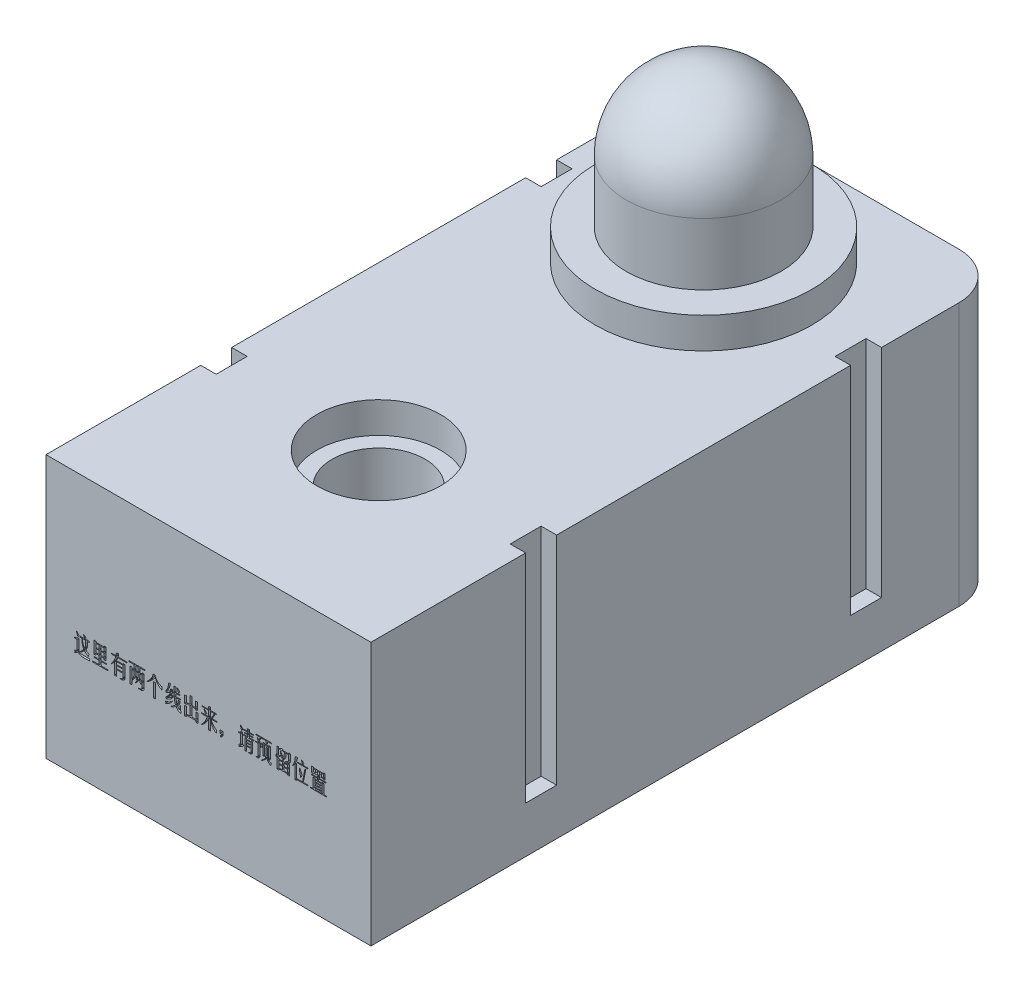
from build123d import *

# Parameters (mm, degrees)
SKETCH_1_W          = 10.5
SKETCH_1_H          = 20.5
SKETCH_1_R          = 1.5
EXTRUDE_1_DEPTH     = 1.5
SKETCH_1_3_R        = 1.5
EXTRUDE_2_DEPTH     = 8.5
SKETCH_1_5_R        = 3.5
EXTRUDE_3_DEPTH     = 9.5
SKETCH_1_6_R        = 2.5
EXTRUDE_4_DEPTH     = 14
FILLET_1_R          = 2.5
SKETCH_2_R          = 2
CUT_EXTRUDE_1_DEPTH = 1
FILLET_2_R          = 1.5
SKETCH_3_W          = 0.09980508
SKETCH_3_H          = 0.115527117
SKETCH_3_H_2        = 0.11284044
SKETCH_3_W_2        = 0.064579758
SKETCH_3_H_3        = 0.139707211
SKETCH_3_H_4        = 0.45942179
SKETCH_3_W_3        = 0.111546854
SKETCH_3_H_5        = 0.091347023
SKETCH_3_H_6        = 0.099407054
SKETCH_3_W_4        = 0.070450645
SKETCH_3_W_5        = 0.067564955
SKETCH_3_W_6        = 0.067465448
CUT_EXTRUDE_2_DEPTH = 0.1


with BuildPart() as part:
    # 草图1 → 凸台-拉伸1 (new body)
    with BuildSketch(Plane(origin=(0, 0, 0), x_dir=(1, 0, 0), z_dir=(0, 1, 0))):
        with Locations((5.25, -10.25)):
            Rectangle(SKETCH_1_W, SKETCH_1_H)
        with Locations((5.25, -15)):
            Circle(SKETCH_1_R, mode=Mode.SUBTRACT)
    extrude(amount=EXTRUDE_1_DEPTH)

    # 草图1<3> → 凸台-拉伸2 (add)
    with BuildSketch(Plane(origin=(0, 0, 0), x_dir=(1, 0, 0), z_dir=(0, 1, 0))):
        Polygon((10.5, 0), (0, 0), (0, -4), (0.5, -4), (0.5, -5), (0, -5), (0, -14.5), (0.5, -14.5), (0.5, -15.5), (0, -15.5), (0, -20.5), (10.5, -20.5), (10.5, -15.5), (10, -15.5), (10, -14.5), (10.5, -14.5), (10.5, -5), (10, -5), (10, -4), (10.5, -4), align=None)
        with Locations((5.25, -15)):
            Circle(SKETCH_1_3_R, mode=Mode.SUBTRACT)
    extrude(amount=EXTRUDE_2_DEPTH)

    # 草图1<5> → 凸台-拉伸3 (add)
    with BuildSketch(Plane(origin=(0, 0, 0), x_dir=(1, 0, 0), z_dir=(0, 1, 0))):
        with Locations((5.25, -4.5)):
            Circle(SKETCH_1_5_R)
    extrude(amount=EXTRUDE_3_DEPTH)

    # 草图1<6> → 凸台-拉伸4 (add)
    with BuildSketch(Plane(origin=(0, 0, 0), x_dir=(1, 0, 0), z_dir=(0, 1, 0))):
        with Locations((5.25, -4.5)):
            Circle(SKETCH_1_6_R)
    extrude(amount=EXTRUDE_4_DEPTH)

    # 圆角1
    fillet_1_edges = [part.edges().sort_by_distance(p)[0] for p in [
        (2.75, 14, 4.5),
    ]]
    fillet(fillet_1_edges, radius=FILLET_1_R)

    # 草图2 → 切除-拉伸1 (cut)
    with BuildSketch(Plane(origin=(0, 8.5, 0), x_dir=(1, 0, 0), z_dir=(0, 1, 0))):
        with Locations((5.25, -15)):
            Circle(SKETCH_2_R)
    extrude(amount=-CUT_EXTRUDE_1_DEPTH, mode=Mode.SUBTRACT)

    # 圆角2
    fillet_2_edges = [part.edges().sort_by_distance(p)[0] for p in [
        (10.5, 4.25, 0),
        (0, 4.25, 0),
    ]]
    fillet(fillet_2_edges, radius=FILLET_2_R)

    # 草图3 → 切除-拉伸2 (cut)
    # profile 1 of 29: a face of its own
    with BuildSketch(Plane.XY.offset(20.5)):
        with BuildLine():
            Line((1.095913454, 3.972671068), (1.260298292, 3.972671068))
            add(Edge.make_bspline(
                [(1.260298292, 3.972671068), (1.258280849, 3.975771954), (1.254026192, 3.982311522), (1.247908695, 3.992951551), (1.241661714, 4.004878086), (1.235057925, 4.017968193), (1.22846206, 4.032417945), (1.221569491, 4.048064196), (1.214508804, 4.064985832), (1.20986178, 4.076746959), (1.207460308, 4.08282483)],
                knots=[0, 0, 0, 0, 0.725378669, 1.529776272, 2.405613347, 3.365573842, 4.40456942, 5.520075485, 6.718433928, 8, 8, 8, 8], degree=3))
            Line((1.207460308, 4.08282483), (1.210445505, 4.085511507))
            add(Edge.make_bspline(
                [(1.210445505, 4.085511507), (1.216628375, 4.081152175), (1.229713317, 4.071926425), (1.250162618, 4.056902556), (1.272252045, 4.039648293), (1.287542869, 4.027415777), (1.295523614, 4.021031256)],
                knots=[0, 0, 0, 0, 0.85020218, 1.79930148, 2.851388686, 4, 4, 4, 4], degree=3))
            add(Edge.make_bspline(
                [(1.295523614, 4.021031256), (1.294786932, 4.016985434), (1.29327203, 4.008665666), (1.288448201, 3.996397107), (1.281217929, 3.984282657), (1.275185171, 3.976650172), (1.272040066, 3.972671068)],
                knots=[0, 0, 0, 0, 0.904039194, 1.85905278, 2.883843107, 4, 4, 4, 4], degree=3))
            Line((1.272040066, 3.972671068), (1.412941356, 3.972671068))
            Line((1.412941356, 3.972671068), (1.412941356, 3.940430942))
            Line((1.412941356, 3.940430942), (1.348361598, 3.940430942))
            Line((1.348361598, 3.940430942), (1.348361598, 3.875950691))
            add(Edge.make_bspline(
                [(1.348361598, 3.875950691), (1.347978507, 3.865724393), (1.347233819, 3.845845544), (1.343701291, 3.816974773), (1.338384407, 3.789952393), (1.331213702, 3.764750247), (1.322329515, 3.741329303), (1.311372378, 3.719845961), (1.298849681, 3.699985547), (1.288774301, 3.688300169), (1.28378184, 3.682509937)],
                knots=[0, 0, 0, 0, 1.178109056, 2.290120299, 3.345658614, 4.346787539, 5.304473109, 6.225261984, 7.120597879, 8, 8, 8, 8], degree=3))
            add(Edge.make_bspline(
                [(1.28378184, 3.682509937), (1.287142046, 3.679367069), (1.294060024, 3.672896544), (1.305199631, 3.663391398), (1.317620892, 3.654144289), (1.330914954, 3.644586804), (1.345527329, 3.635324187), (1.361075557, 3.625857751), (1.377794985, 3.616481096), (1.389376328, 3.610405567), (1.395328695, 3.607282977)],
                knots=[0, 0, 0, 0, 0.817815652, 1.683715951, 2.601135979, 3.569596464, 4.593386613, 5.675319291, 6.805203104, 8, 8, 8, 8], degree=3))
            add(Edge.make_bspline(
                [(1.395328695, 3.607282977), (1.39347879, 3.60500337), (1.389752078, 3.600411002), (1.385227093, 3.592737099), (1.38157112, 3.584498584), (1.379054789, 3.575640888), (1.377196678, 3.566261465), (1.376481538, 3.55624986), (1.376553216, 3.545662621), (1.377320883, 3.538453522), (1.377716033, 3.534742695)],
                knots=[0, 0, 0, 0, 0.913903584, 1.841098687, 2.766852031, 3.715410598, 4.704774002, 5.741809014, 6.837614059, 8, 8, 8, 8], degree=3))
            Line((1.377716033, 3.534742695), (1.374830343, 3.532056017))
            add(Edge.make_bspline(
                [(1.374830343, 3.532056017), (1.368563722, 3.53568648), (1.356110866, 3.542900837), (1.338109914, 3.554549693), (1.320898374, 3.566835026), (1.304293223, 3.579557517), (1.288531435, 3.592990533), (1.273422389, 3.606962201), (1.259104887, 3.621539352), (1.25013558, 3.631752508), (1.245670828, 3.636836426)],
                knots=[0, 0, 0, 0, 1.039653309, 2.065970493, 3.076792519, 4.074995283, 5.068256136, 6.048822047, 7.028740216, 8, 8, 8, 8], degree=3))
            add(Edge.make_bspline(
                [(1.245670828, 3.636836426), (1.241336469, 3.632910428), (1.23242074, 3.62483469), (1.218395001, 3.612559551), (1.203444303, 3.599639474), (1.187346342, 3.586230399), (1.170397997, 3.572084868), (1.152336864, 3.557442997), (1.133254266, 3.542272597), (1.120195673, 3.531953201), (1.113526115, 3.526682663)],
                knots=[0, 0, 0, 0, 0.815650589, 1.677784758, 2.599569344, 3.571587547, 4.599874132, 5.678593273, 6.814362566, 8, 8, 8, 8], degree=3))
            Line((1.113526115, 3.526682663), (1.090042567, 3.526682663))
            add(Edge.make_bspline(
                [(1.090042567, 3.526682663), (1.095233721, 3.531307416), (1.105856456, 3.540771115), (1.121794763, 3.555621667), (1.137728816, 3.571771145), (1.154247319, 3.588599571), (1.170753857, 3.606714832), (1.187867427, 3.625515878), (1.204926953, 3.645625324), (1.216361605, 3.659381461), (1.222187279, 3.666389874)],
                knots=[0, 0, 0, 0, 0.866723532, 1.773589007, 2.715069236, 3.694668628, 4.71299205, 5.769963408, 6.863851296, 8, 8, 8, 8], degree=3))
            add(Edge.make_bspline(
                [(1.222187279, 3.666389874), (1.217458255, 3.673530674), (1.207925773, 3.687924668), (1.196242983, 3.711480471), (1.186398123, 3.736595473), (1.178447973, 3.763397994), (1.172368938, 3.791839706), (1.168394924, 3.821983015), (1.166115449, 3.853791277), (1.166279858, 3.875548991), (1.166364099, 3.886697399)],
                knots=[0, 0, 0, 0, 0.888724228, 1.79143663, 2.72404877, 3.687443521, 4.691378837, 5.741180022, 6.842605974, 8, 8, 8, 8], degree=3))
            Line((1.166364099, 3.886697399), (1.166364099, 3.940430942))
            Line((1.166364099, 3.940430942), (1.095913454, 3.940430942))
            Line((1.095913454, 3.940430942), (1.095913454, 3.972671068))
        make_face()
        with BuildLine():
            Line((1.28378184, 3.843710565), (1.28378184, 3.940430942))
            Line((1.28378184, 3.940430942), (1.178105873, 3.940430942))
            add(Edge.make_bspline(
                [(1.178105873, 3.940430942), (1.178550541, 3.928645853), (1.17941946, 3.905616776), (1.183250521, 3.872040835), (1.188964999, 3.840308906), (1.196693269, 3.810404658), (1.206558435, 3.782342432), (1.218416628, 3.756099245), (1.232160195, 3.731595007), (1.243125929, 3.716735581), (1.248556518, 3.709376708)],
                knots=[0, 0, 0, 0, 1.151382588, 2.249900693, 3.296949585, 4.297874107, 5.262918502, 6.197967662, 7.107574839, 8, 8, 8, 8], degree=3))
            add(Edge.make_bspline(
                [(1.248556518, 3.709376708), (1.251187115, 3.71414777), (1.25647931, 3.723746116), (1.263076785, 3.738968477), (1.268854683, 3.754786194), (1.27373264, 3.771270485), (1.27774053, 3.788406627), (1.280669393, 3.806263444), (1.282799341, 3.824761666), (1.283451367, 3.837336916), (1.28378184, 3.843710565)],
                knots=[0, 0, 0, 0, 0.931960969, 1.874904256, 2.835654549, 3.812717671, 4.81514298, 5.84542116, 6.907971633, 8, 8, 8, 8], degree=3))
        make_face(mode=Mode.SUBTRACT)
    # profile 2 of 29: a face of its own
    with BuildSketch(Plane.XY.offset(20.5)):
        with BuildLine():
            Line((0.978495712, 4.066704767), (0.981480909, 4.069391444))
            add(Edge.make_bspline(
                [(0.981480909, 4.069391444), (0.983789773, 4.067457174), (0.988743695, 4.063306982), (0.996201726, 4.056185868), (1.004533991, 4.04816311), (1.01330278, 4.038883015), (1.022787343, 4.028598461), (1.032966323, 4.017272822), (1.04364076, 4.004708142), (1.051005047, 3.995990554), (1.054817244, 3.991477808)],
                knots=[0, 0, 0, 0, 0.674585747, 1.447398482, 2.309149883, 3.265643574, 4.306822212, 5.443477519, 6.67659037, 8, 8, 8, 8], degree=3))
            add(Edge.make_bspline(
                [(1.054817244, 3.991477808), (1.057545187, 3.989032178), (1.062492758, 3.984596627), (1.067360431, 3.980073591), (1.069544215, 3.978044422)],
                knots=[0, 0, 0, 0, 1.10274006, 2, 2, 2, 2], degree=3))
            add(Edge.make_bspline(
                [(1.069544215, 3.978044422), (1.069164683, 3.976975282), (1.06826855, 3.974450879), (1.066167663, 3.970276808), (1.063434685, 3.965039528), (1.059772079, 3.958824625), (1.055338383, 3.951618429), (1.049989112, 3.943439735), (1.043966381, 3.934165084), (1.03954181, 3.927717002), (1.037204583, 3.924310879)],
                knots=[0, 0, 0, 0, 0.432965086, 1.022297167, 1.781678756, 2.689944667, 3.776353449, 5.013286663, 6.422303896, 8, 8, 8, 8], degree=3))
            Line((1.037204583, 3.924310879), (1.034318893, 3.924310879))
            add(Edge.make_bspline(
                [(1.034318893, 3.924310879), (1.032041888, 3.927760776), (1.02714743, 3.935176383), (1.020502236, 3.947820928), (1.013590361, 3.962466297), (1.006875528, 3.979322564), (0.99970416, 3.998140488), (0.992796751, 4.019155287), (0.985413635, 4.042154745), (0.980864849, 4.058297278), (0.978495712, 4.066704767)],
                knots=[0, 0, 0, 0, 0.645879335, 1.388327993, 2.230390946, 3.176965937, 4.223894957, 5.378315131, 6.634552045, 8, 8, 8, 8], degree=3))
        make_face()
    # profile 3 of 29: a face of its own
    with BuildSketch(Plane.XY.offset(20.5)):
        with BuildLine():
            Line((0.919786842, 3.865203982), (1.007850148, 3.865203982))
            Line((1.007850148, 3.865203982), (1.007850148, 3.886697399))
            Line((1.007850148, 3.886697399), (1.066559018, 3.886697399))
            Line((1.066559018, 3.886697399), (1.066559018, 3.542802726))
            add(Edge.make_bspline(
                [(1.066559018, 3.542802726), (1.067178129, 3.538755232), (1.068371441, 3.530953844), (1.072435508, 3.520164988), (1.078071569, 3.510749901), (1.085509782, 3.502879805), (1.094537286, 3.496379246), (1.105315992, 3.491549604), (1.117658041, 3.488052678), (1.126505738, 3.486956508), (1.131138776, 3.486382506)],
                knots=[0, 0, 0, 0, 1.040704688, 2.005918074, 2.91596485, 3.818646532, 4.744906194, 5.73162667, 6.812181273, 8, 8, 8, 8], degree=3))
            Line((1.131138776, 3.486382506), (1.319007163, 3.486382506))
            add(Edge.make_bspline(
                [(1.319007163, 3.486382506), (1.32547564, 3.486422061), (1.337718069, 3.486496925), (1.354967833, 3.487008182), (1.370044394, 3.487691483), (1.37931098, 3.488634186), (1.38358692, 3.489069183)],
                knots=[0, 0, 0, 0, 1.200338658, 2.271795841, 3.20254348, 4, 4, 4, 4], degree=3))
            add(Edge.make_bspline(
                [(1.38358692, 3.489069183), (1.392177654, 3.489069183), (1.408828418, 3.489069183), (1.425479182, 3.489069183), (1.433539214, 3.489069183)],
                knots=[0, 0, 0, 0, 1.03187251, 2, 2, 2, 2], degree=3))
            add(Edge.make_bspline(
                [(1.433539214, 3.489069183), (1.429297226, 3.486682576), (1.421508106, 3.482300297), (1.41160581, 3.474820495), (1.40448952, 3.467171736), (1.400147908, 3.45923192), (1.39878435, 3.450976462), (1.400706671, 3.442680618), (1.405653908, 3.434599113), (1.410369224, 3.429860467), (1.412941356, 3.427275609)],
                knots=[0, 0, 0, 0, 1.430098154, 2.625940119, 3.634322779, 4.480585413, 5.250266506, 6.038387883, 6.929970757, 8, 8, 8, 8], degree=3))
            Line((1.412941356, 3.427275609), (1.178105873, 3.427275609))
            add(Edge.make_bspline(
                [(1.178105873, 3.427275609), (1.172756887, 3.427768938), (1.162383564, 3.428725653), (1.147378173, 3.431285384), (1.133373656, 3.434407479), (1.120322656, 3.43829064), (1.108301433, 3.442933875), (1.097279073, 3.448327635), (1.087248416, 3.454403422), (1.078217538, 3.461255696), (1.070367728, 3.469023107), (1.063289405, 3.477301346), (1.057272189, 3.486408111), (1.052446616, 3.496311256), (1.048481172, 3.506894555), (1.045676527, 3.518217943), (1.043721198, 3.530268908), (1.043294596, 3.538549419), (1.04307547, 3.542802726)],
                knots=[0, 0, 0, 0, 1.298424345, 2.518042864, 3.677642914, 4.766171255, 5.80724883, 6.79003779, 7.729492876, 8.639030164, 9.523796171, 10.394602593, 11.268800248, 12.154728701, 13.053058448, 13.996476343, 14.970884766, 16, 16, 16, 16], degree=3))
            add(Edge.make_bspline(
                [(1.04307547, 3.542802726), (1.042545117, 3.539174347), (1.041504792, 3.53205702), (1.038830949, 3.521764714), (1.035593834, 3.511949846), (1.031470931, 3.502684889), (1.026715699, 3.493908785), (1.021199214, 3.485668745), (1.014898592, 3.47800651), (1.00790184, 3.470826488), (1.000231664, 3.464099637), (0.991710142, 3.458064406), (0.982512471, 3.452454542), (0.972570002, 3.447389571), (0.961870774, 3.442935189), (0.950477162, 3.438943148), (0.938348096, 3.435460215), (0.929947461, 3.433599252), (0.925657729, 3.432648963)],
                knots=[0, 0, 0, 0, 1.013811141, 1.98866373, 2.937601977, 3.870294142, 4.790167374, 5.696250834, 6.609232156, 7.530751776, 8.467408261, 9.427506979, 10.415871534, 11.445998304, 12.511211258, 13.619888404, 14.784610886, 16, 16, 16, 16], degree=3))
            add(Edge.make_bspline(
                [(0.925657729, 3.432648963), (0.926747272, 3.435346883), (0.928900896, 3.440679672), (0.931052003, 3.449058871), (0.931902973, 3.457637785), (0.931708184, 3.466361653), (0.930376496, 3.475212045), (0.927941223, 3.484208512), (0.924452281, 3.493416679), (0.921373416, 3.499412733), (0.919786842, 3.502502569)],
                knots=[0, 0, 0, 0, 0.95813449, 1.893877356, 2.838956607, 3.790083619, 4.762327281, 5.780366032, 6.856196937, 8, 8, 8, 8], degree=3))
            Line((0.919786842, 3.502502569), (0.972624825, 3.502502569))
            add(Edge.make_bspline(
                [(0.972624825, 3.502502569), (0.975384175, 3.502593165), (0.980577596, 3.502763676), (0.987839048, 3.504138008), (0.994026441, 3.506407672), (0.999211206, 3.509586666), (1.003073925, 3.513970558), (1.005952962, 3.51914239), (1.00750843, 3.525336852), (1.007731654, 3.529726092), (1.007850148, 3.532056017)],
                knots=[0, 0, 0, 0, 1.259312719, 2.370174537, 3.357506887, 4.256563111, 5.11436319, 5.995509929, 6.935963619, 8, 8, 8, 8], degree=3))
            Line((1.007850148, 3.532056017), (1.007850148, 3.832963857))
            Line((1.007850148, 3.832963857), (0.919786842, 3.832963857))
            Line((0.919786842, 3.832963857), (0.919786842, 3.865203982))
        make_face()
    # profile 4 of 29: a face of its own
    with BuildSketch(Plane.XY.offset(20.5)):
        Polygon((1.558519454, 3.693256646), (1.558519454, 4.085511507), (1.617228325, 4.085511507), (1.617228325, 4.055958059), (1.875547356, 4.055958059), (1.875547356, 4.085511507), (1.934256227, 4.085511507), (1.934256227, 3.69863), (1.875547356, 3.69863), (1.875547356, 3.73624348), (1.775742276, 3.73624348), (1.775742276, 3.631463071), (1.957739775, 3.631463071), (1.957739775, 3.601909623), (1.775742276, 3.601909623), (1.775742276, 3.481009152), (1.998835984, 3.481009152), (1.998835984, 3.451455703), (1.499810583, 3.451455703), (1.499810583, 3.481009152), (1.717033405, 3.481009152), (1.717033405, 3.601909623), (1.54677768, 3.601909623), (1.54677768, 3.631463071), (1.717033405, 3.631463071), (1.717033405, 3.73624348), (1.617228325, 3.73624348), (1.617228325, 3.693256646), align=None)
        with Locations((1.667130865, 3.968641052)):
            Rectangle(SKETCH_3_W, SKETCH_3_H, mode=Mode.SUBTRACT)
        with Locations((1.825644816, 3.968641052)):
            Rectangle(SKETCH_3_W, SKETCH_3_H, mode=Mode.SUBTRACT)
        with Locations((1.667130865, 3.824903825)):
            Rectangle(SKETCH_3_W, SKETCH_3_H_2, mode=Mode.SUBTRACT)
        with Locations((1.825644816, 3.824903825)):
            Rectangle(SKETCH_3_W, SKETCH_3_H_2, mode=Mode.SUBTRACT)
    # profile 5 of 29: a face of its own
    with BuildSketch(Plane.XY.offset(20.5)):
        with BuildLine():
            Line((2.115059647, 3.978044422), (2.115059647, 4.004911193))
            Line((2.115059647, 4.004911193), (2.261831824, 4.004911193))
            add(Edge.make_bspline(
                [(2.261831824, 4.004911193), (2.261934561, 4.007533741), (2.262171835, 4.013590605), (2.263391147, 4.023839997), (2.265146749, 4.036458347), (2.266803537, 4.045615123), (2.267702711, 4.050584705)],
                knots=[0, 0, 0, 0, 0.683095226, 1.577631659, 2.685328, 4, 4, 4, 4], degree=3))
            add(Edge.make_bspline(
                [(2.267702711, 4.050584705), (2.268180444, 4.055230705), (2.269078602, 4.063965389), (2.270638445, 4.076225587), (2.271901541, 4.086836958), (2.273050366, 4.093310048), (2.273573598, 4.096258216)],
                knots=[0, 0, 0, 0, 1.21674179, 2.287527569, 3.220054908, 4, 4, 4, 4], degree=3))
            Line((2.273573598, 4.096258216), (2.34989513, 4.096258216))
            add(Edge.make_bspline(
                [(2.34989513, 4.096258216), (2.349372352, 4.094240451), (2.348222806, 4.089803552), (2.346933208, 4.082367024), (2.345398221, 4.073656354), (2.344502271, 4.067371387), (2.344024243, 4.06401809)],
                knots=[0, 0, 0, 0, 0.762559953, 1.676806997, 2.760477787, 4, 4, 4, 4], degree=3))
            add(Edge.make_bspline(
                [(2.344024243, 4.06401809), (2.343111527, 4.057740659), (2.341412385, 4.046054391), (2.338344467, 4.029957919), (2.335649994, 4.016450696), (2.333324442, 4.008481725), (2.332282469, 4.004911193)],
                knots=[0, 0, 0, 0, 1.261843342, 2.349088274, 3.260302021, 4, 4, 4, 4], degree=3))
            Line((2.332282469, 4.004911193), (2.614085048, 4.004911193))
            Line((2.614085048, 4.004911193), (2.614085048, 3.978044422))
            Line((2.614085048, 3.978044422), (2.320540695, 3.978044422))
            add(Edge.make_bspline(
                [(2.320540695, 3.978044422), (2.319742807, 3.976121421), (2.318050232, 3.972042118), (2.315384086, 3.965503857), (2.312146392, 3.958291232), (2.308697585, 3.950249786), (2.304927705, 3.941425773), (2.300619963, 3.931948331), (2.296053344, 3.921646438), (2.292849313, 3.914557177), (2.291186259, 3.910877493)],
                knots=[0, 0, 0, 0, 0.681638067, 1.445973031, 2.311528995, 3.269743906, 4.310661187, 5.452964495, 6.677960355, 8, 8, 8, 8], degree=3))
            add(Edge.make_bspline(
                [(2.291186259, 3.910877493), (2.290250013, 3.908558677), (2.288476564, 3.904166351), (2.286079303, 3.897899307), (2.284119528, 3.892381592), (2.282493634, 3.887637614), (2.2812194, 3.883651756), (2.2801591, 3.880434442), (2.27965088, 3.877921474), (2.279503634, 3.876515476), (2.279444485, 3.875950691)],
                knots=[0, 0, 0, 0, 1.625378636, 3.078809761, 4.360796818, 5.43117186, 6.337929929, 7.081322882, 7.630970298, 8, 8, 8, 8], degree=3))
            Line((2.279444485, 3.875950691), (2.484925533, 3.875950691))
            Line((2.484925533, 3.875950691), (2.484925533, 3.897444108))
            Line((2.484925533, 3.897444108), (2.549505291, 3.897444108))
            Line((2.549505291, 3.897444108), (2.549505291, 3.502502569))
            add(Edge.make_bspline(
                [(2.549505291, 3.502502569), (2.549433819, 3.500604284), (2.549291935, 3.496835831), (2.547989663, 3.491301872), (2.546145563, 3.485833216), (2.543258018, 3.480589389), (2.539808411, 3.475358042), (2.535398936, 3.470382367), (2.530407731, 3.465374809), (2.524395206, 3.460776374), (2.517868025, 3.455985644), (2.510327594, 3.451645628), (2.502236815, 3.447055846), (2.493167293, 3.44298362), (2.483466839, 3.438737503), (2.472874677, 3.434812934), (2.461560737, 3.430929812), (2.453720715, 3.428514318), (2.44970021, 3.427275609)],
                knots=[0, 0, 0, 0, 0.684992548, 1.359839628, 2.046089813, 2.764666069, 3.516090426, 4.306657927, 5.162851406, 6.06712612, 7.038444527, 8.086960309, 9.208264543, 10.398877996, 11.677041128, 13.035226686, 14.479610763, 16, 16, 16, 16], degree=3))
            add(Edge.make_bspline(
                [(2.44970021, 3.427275609), (2.448825959, 3.429586355), (2.447360403, 3.433459987), (2.44458312, 3.437753224), (2.440874314, 3.440088716), (2.438939318, 3.43871744), (2.437958436, 3.438022318)],
                knots=[0, 0, 0, 0, 1.56262898, 2.619521429, 3.300212681, 4, 4, 4, 4], degree=3))
            Line((2.437958436, 3.438022318), (2.396862227, 3.427275609))
            Line((2.396862227, 3.427275609), (2.39099134, 3.432648963))
            add(Edge.make_bspline(
                [(2.39099134, 3.432648963), (2.394916758, 3.434281276), (2.402543208, 3.437452596), (2.413433492, 3.442489596), (2.42365094, 3.44719666), (2.432995319, 3.452032504), (2.441634959, 3.456628533), (2.449434728, 3.461264613), (2.456502963, 3.465696621), (2.462777469, 3.470080194), (2.468320351, 3.474331331), (2.472978765, 3.478654864), (2.477016837, 3.482751723), (2.48011773, 3.486908605), (2.482576181, 3.49087149), (2.484201748, 3.494795969), (2.485095874, 3.498682169), (2.484981901, 3.50123834), (2.484925533, 3.502502569)],
                knots=[0, 0, 0, 0, 1.672298708, 3.249005048, 4.72000612, 6.09726944, 7.387595304, 8.56922477, 9.666110035, 10.668840794, 11.579838217, 12.411085823, 13.167922865, 13.838642148, 14.447342891, 14.997413068, 15.504141248, 16, 16, 16, 16], degree=3))
            Line((2.484925533, 3.502502569), (2.484925533, 3.849083919))
            Line((2.484925533, 3.849083919), (2.273573598, 3.849083919))
            Line((2.273573598, 3.849083919), (2.273573598, 3.763110251))
            Line((2.273573598, 3.763110251), (2.455571098, 3.763110251))
            Line((2.455571098, 3.763110251), (2.455571098, 3.73624348))
            Line((2.455571098, 3.73624348), (2.273573598, 3.73624348))
            Line((2.273573598, 3.73624348), (2.273573598, 3.650269811))
            Line((2.273573598, 3.650269811), (2.455571098, 3.650269811))
            Line((2.455571098, 3.650269811), (2.455571098, 3.62340304))
            Line((2.455571098, 3.62340304), (2.273573598, 3.62340304))
            Line((2.273573598, 3.62340304), (2.273573598, 3.432648963))
            Line((2.273573598, 3.432648963), (2.20899384, 3.432648963))
            Line((2.20899384, 3.432648963), (2.20899384, 3.795350377))
            add(Edge.make_bspline(
                [(2.20899384, 3.795350377), (2.205953275, 3.792089398), (2.199649103, 3.78532823), (2.189621019, 3.775018536), (2.179053269, 3.763863998), (2.171686818, 3.756269853), (2.167897631, 3.752363542)],
                knots=[0, 0, 0, 0, 0.899616582, 1.865225015, 2.901904938, 4, 4, 4, 4], degree=3))
            add(Edge.make_bspline(
                [(2.167897631, 3.752363542), (2.165544537, 3.749973544), (2.161035803, 3.745394096), (2.154489145, 3.738804712), (2.148601148, 3.732621451), (2.143047729, 3.727092564), (2.138246104, 3.721913094), (2.133891166, 3.717309242), (2.130168048, 3.713172742), (2.127861473, 3.710571968), (2.126801421, 3.709376708)],
                knots=[0, 0, 0, 0, 1.353333463, 2.593106288, 3.747825374, 4.798331929, 5.754581019, 6.597323251, 7.355360142, 8, 8, 8, 8], degree=3))
            Line((2.126801421, 3.709376708), (2.103317873, 3.709376708))
            add(Edge.make_bspline(
                [(2.103317873, 3.709376708), (2.112588559, 3.719893146), (2.130881381, 3.740644073), (2.155954024, 3.773050319), (2.178593278, 3.805970077), (2.198963361, 3.839317926), (2.216919181, 3.873209363), (2.232489185, 3.907583717), (2.245645872, 3.942488343), (2.252530741, 3.966220519), (2.255960937, 3.978044422)],
                knots=[0, 0, 0, 0, 1.078459496, 2.128005149, 3.1502001, 4.151186877, 5.132987156, 6.099277867, 7.053017581, 8, 8, 8, 8], degree=3))
            Line((2.255960937, 3.978044422), (2.115059647, 3.978044422))
        make_face()
    # profile 6 of 29: a face of its own
    with BuildSketch(Plane.XY.offset(20.5)):
        with BuildLine():
            Line((2.777275808, 3.908190816), (2.847726453, 3.908190816))
            Line((2.847726453, 3.908190816), (2.847726453, 4.047898027))
            Line((2.847726453, 4.047898027), (2.689212502, 4.047898027))
            Line((2.689212502, 4.047898027), (2.689212502, 4.077451476))
            Line((2.689212502, 4.077451476), (3.199979677, 4.077451476))
            Line((3.199979677, 4.077451476), (3.199979677, 4.047898027))
            Line((3.199979677, 4.047898027), (3.029723952, 4.047898027))
            Line((3.029723952, 4.047898027), (3.029723952, 3.908190816))
            Line((3.029723952, 3.908190816), (3.100174597, 3.908190816))
            Line((3.100174597, 3.908190816), (3.100174597, 3.945804296))
            Line((3.100174597, 3.945804296), (3.158883468, 3.945804296))
            Line((3.158883468, 3.945804296), (3.158883468, 3.507875923))
            add(Edge.make_bspline(
                [(3.158883468, 3.507875923), (3.159051045, 3.505786163), (3.159378835, 3.501698492), (3.1587095, 3.495668172), (3.157356356, 3.489865896), (3.154928579, 3.484413319), (3.151657449, 3.479265717), (3.147629179, 3.474307444), (3.142659647, 3.469679943), (3.136773778, 3.465383419), (3.130097625, 3.461297598), (3.122497909, 3.45752637), (3.114017718, 3.454103341), (3.104742303, 3.450780878), (3.094568137, 3.447825797), (3.083510409, 3.445145839), (3.071581069, 3.442792427), (3.063327748, 3.441417103), (3.059078387, 3.440708995)],
                knots=[0, 0, 0, 0, 0.756879492, 1.480492367, 2.184843085, 2.904964803, 3.627482275, 4.386546676, 5.210037366, 6.076476802, 7.019097411, 8.038775171, 9.141895029, 10.326106418, 11.601988161, 12.972868678, 14.441430603, 16, 16, 16, 16], degree=3))
            add(Edge.make_bspline(
                [(3.059078387, 3.440708995), (3.059036745, 3.441942875), (3.058958562, 3.444259449), (3.057991067, 3.44740898), (3.056302305, 3.449852478), (3.054000889, 3.451663342), (3.050952664, 3.452589279), (3.047338113, 3.453002234), (3.043113478, 3.452488083), (3.040164887, 3.451816614), (3.038580036, 3.451455703)],
                knots=[0, 0, 0, 0, 1.047026676, 1.965762878, 2.756019178, 3.54021204, 4.405434829, 5.427079926, 6.617069453, 8, 8, 8, 8], degree=3))
            Line((3.038580036, 3.451455703), (2.991612939, 3.446082349))
            Line((2.991612939, 3.446082349), (2.988627742, 3.459515735))
            add(Edge.make_bspline(
                [(2.988627742, 3.459515735), (2.994668422, 3.460791434), (3.006133643, 3.463212713), (3.022308716, 3.466915128), (3.036591061, 3.470256895), (3.048918158, 3.47345959), (3.059349081, 3.476302519), (3.067854208, 3.478882132), (3.074488928, 3.4811543), (3.078129315, 3.48293791), (3.079676245, 3.483695829)],
                knots=[0, 0, 0, 0, 1.570287077, 2.98040824, 4.220448853, 5.300839206, 6.219829545, 6.969723418, 7.562198797, 8, 8, 8, 8], degree=3))
            add(Edge.make_bspline(
                [(3.079676245, 3.483695829), (3.081293246, 3.484377075), (3.084439308, 3.485702519), (3.088626792, 3.48844587), (3.092260613, 3.491510509), (3.095202937, 3.495042042), (3.097411321, 3.499005669), (3.099017605, 3.503365854), (3.100042718, 3.508160318), (3.10012976, 3.511519122), (3.100174597, 3.513249277)],
                knots=[0, 0, 0, 0, 1.090188054, 2.121087185, 3.10197833, 4.040447895, 4.964959193, 5.912245118, 6.924575488, 8, 8, 8, 8], degree=3))
            Line((3.100174597, 3.513249277), (3.100174597, 3.671763228))
            add(Edge.make_bspline(
                [(3.100174597, 3.671763228), (3.098492399, 3.670497868), (3.095036122, 3.667898035), (3.090752229, 3.662608719), (3.086945471, 3.656291835), (3.08382458, 3.648719414), (3.081127553, 3.640034353), (3.079121998, 3.630125816), (3.077498519, 3.619100053), (3.076967943, 3.61133524), (3.076691049, 3.607282977)],
                knots=[0, 0, 0, 0, 0.710784122, 1.460390801, 2.287137473, 3.203424649, 4.227047935, 5.364271441, 6.624478687, 8, 8, 8, 8], degree=3))
            add(Edge.make_bspline(
                [(3.076691049, 3.607282977), (3.076691049, 3.606122067), (3.076691049, 3.604098767), (3.076691049, 3.601577934), (3.076691049, 3.600052167), (3.076691049, 3.59938879), (3.076691049, 3.599222946)],
                knots=[0, 0, 0, 0, 1.728395062, 3.012345679, 3.75308642, 4, 4, 4, 4], degree=3))
            add(Edge.make_bspline(
                [(3.076691049, 3.599222946), (3.072656186, 3.60282185), (3.06439926, 3.610186635), (3.054006804, 3.623794577), (3.0448497, 3.63944342), (3.037482386, 3.657408209), (3.03098821, 3.677323735), (3.026266295, 3.6995107), (3.022777537, 3.723850491), (3.021586545, 3.740842893), (3.020967375, 3.749676865)],
                knots=[0, 0, 0, 0, 0.785096197, 1.60661781, 2.478151776, 3.416590342, 4.425350965, 5.522446812, 6.711975079, 8, 8, 8, 8], degree=3))
            add(Edge.make_bspline(
                [(3.020967375, 3.749676865), (3.018541592, 3.741770905), (3.013619278, 3.725728407), (3.003672142, 3.702050043), (2.991711489, 3.678315804), (2.977725405, 3.654424929), (2.961517768, 3.630563181), (2.94329758, 3.60654137), (2.922817851, 3.582562616), (2.908094223, 3.566921689), (2.900564436, 3.558922789)],
                knots=[0, 0, 0, 0, 0.870622765, 1.766637266, 2.700983849, 3.668700781, 4.68034361, 5.737569573, 6.842974171, 8, 8, 8, 8], degree=3))
            Line((2.900564436, 3.558922789), (2.882951775, 3.558922789))
            add(Edge.make_bspline(
                [(2.882951775, 3.558922789), (2.889001886, 3.567581301), (2.900585181, 3.584158535), (2.916477607, 3.608455078), (2.930099309, 3.631107936), (2.937939546, 3.645924373), (2.941660646, 3.652956488)],
                knots=[0, 0, 0, 0, 1.142408698, 2.187208954, 3.139620747, 4, 4, 4, 4], degree=3))
            add(Edge.make_bspline(
                [(2.941660646, 3.652956488), (2.939239123, 3.65618318), (2.934288117, 3.662780422), (2.927344984, 3.673344562), (2.920701748, 3.684686276), (2.914342209, 3.696744762), (2.908217277, 3.709537642), (2.902535591, 3.723166392), (2.896908549, 3.737469832), (2.893527886, 3.747341168), (2.891807859, 3.752363542)],
                knots=[0, 0, 0, 0, 0.86641045, 1.771448635, 2.713558994, 3.688815798, 4.699047515, 5.759006602, 6.859819131, 8, 8, 8, 8], degree=3))
            add(Edge.make_bspline(
                [(2.891807859, 3.752363542), (2.891243078, 3.749702085), (2.890076589, 3.744205158), (2.887630297, 3.7358482), (2.884667059, 3.727060091), (2.880913254, 3.717902883), (2.876658275, 3.708267839), (2.871765419, 3.69821844), (2.866277014, 3.687773549), (2.860217857, 3.676895764), (2.853392313, 3.665668702), (2.846061953, 3.653936874), (2.838086966, 3.641802838), (2.829500489, 3.629226211), (2.820295509, 3.616241936), (2.810373189, 3.602892092), (2.799967692, 3.589059998), (2.792714065, 3.57977469), (2.789017582, 3.575042852)],
                knots=[0, 0, 0, 0, 0.632169589, 1.305671648, 2.022437203, 2.786911286, 3.604905759, 4.470350783, 5.384164997, 6.347128626, 7.363861804, 8.437654913, 9.562379974, 10.738459261, 11.977009849, 13.261426745, 14.604409617, 16, 16, 16, 16], degree=3))
            Line((2.789017582, 3.575042852), (2.777275808, 3.575042852))
            Line((2.777275808, 3.575042852), (2.777275808, 3.448769026))
            Line((2.777275808, 3.448769026), (2.718566937, 3.448769026))
            Line((2.718566937, 3.448769026), (2.718566937, 3.945804296))
            Line((2.718566937, 3.945804296), (2.777275808, 3.945804296))
            Line((2.777275808, 3.945804296), (2.777275808, 3.908190816))
        make_face()
        with Locations((2.938725202, 3.978044422)):
            Rectangle(SKETCH_3_W_2, SKETCH_3_H_3, mode=Mode.SUBTRACT)
        with BuildLine():
            Line((2.847726453, 3.841023888), (2.847726453, 3.881324045))
            Line((2.847726453, 3.881324045), (2.777275808, 3.881324045))
            Line((2.777275808, 3.881324045), (2.777275808, 3.58578956))
            add(Edge.make_bspline(
                [(2.777275808, 3.58578956), (2.782934461, 3.594856555), (2.79426607, 3.613013459), (2.808551365, 3.641914859), (2.820560679, 3.672065255), (2.830609561, 3.703390809), (2.838186966, 3.73605808), (2.843784701, 3.769917745), (2.847114819, 3.805068183), (2.847520389, 3.828910137), (2.847726453, 3.841023888)],
                knots=[0, 0, 0, 0, 0.954622302, 1.911657283, 2.875953303, 3.852700368, 4.848429871, 5.869760621, 6.917656292, 8, 8, 8, 8], degree=3))
        make_face(mode=Mode.SUBTRACT)
        with BuildLine():
            Line((2.971015081, 3.806097085), (2.971015081, 3.881324045))
            Line((2.971015081, 3.881324045), (2.906435323, 3.881324045))
            Line((2.906435323, 3.881324045), (2.906435323, 3.843710565))
            add(Edge.make_bspline(
                [(2.906435323, 3.843710565), (2.90546011, 3.834325104), (2.903413831, 3.814631689), (2.901543439, 3.794920779), (2.900564436, 3.784603668)],
                knots=[0, 0, 0, 0, 0.953157294, 2, 2, 2, 2], degree=3))
            add(Edge.make_bspline(
                [(2.900564436, 3.784603668), (2.904492094, 3.780403878), (2.911868652, 3.772516224), (2.921979072, 3.761300821), (2.930513154, 3.751598018), (2.937689283, 3.743625228), (2.943048232, 3.736878747), (2.946988938, 3.73180726), (2.949571957, 3.728257934), (2.950274543, 3.726204577), (2.95051673, 3.725496771)],
                knots=[0, 0, 0, 0, 1.77853045, 3.340269681, 4.670223766, 5.775278577, 6.658114346, 7.331173943, 7.769451087, 8, 8, 8, 8], degree=3))
            add(Edge.make_bspline(
                [(2.95051673, 3.725496771), (2.95070515, 3.724570877), (2.951191969, 3.722178664), (2.951255016, 3.717729107), (2.951015248, 3.711728496), (2.950517727, 3.704124332), (2.949601946, 3.694935856), (2.948283994, 3.684123599), (2.946578189, 3.671757354), (2.945314008, 3.662972795), (2.944645843, 3.658329843)],
                knots=[0, 0, 0, 0, 0.334883125, 0.865230016, 1.572054191, 2.468802231, 3.568886933, 4.849643041, 6.334924229, 8, 8, 8, 8], degree=3))
            add(Edge.make_bspline(
                [(2.944645843, 3.658329843), (2.946758084, 3.663982138), (2.950997072, 3.675325547), (2.956364794, 3.69276061), (2.960802776, 3.710652453), (2.96461445, 3.728894217), (2.967523487, 3.747591918), (2.969424612, 3.766729742), (2.97082442, 3.786274716), (2.97095125, 3.79946075), (2.971015081, 3.806097085)],
                knots=[0, 0, 0, 0, 0.95907834, 1.924743397, 2.897936639, 3.888599463, 4.886392971, 5.904241724, 6.945235874, 8, 8, 8, 8], degree=3))
        make_face(mode=Mode.SUBTRACT)
        with BuildLine():
            Line((3.100174597, 3.687883291), (3.100174597, 3.881324045))
            Line((3.100174597, 3.881324045), (3.029723952, 3.881324045))
            Line((3.029723952, 3.881324045), (3.029723952, 3.787290345))
            add(Edge.make_bspline(
                [(3.029723952, 3.787290345), (3.030196243, 3.783417072), (3.031171127, 3.775422012), (3.035163468, 3.763509694), (3.041008375, 3.751399047), (3.048901371, 3.739079252), (3.058851557, 3.726566832), (3.070733224, 3.713738437), (3.084633928, 3.700682616), (3.094849839, 3.692268771), (3.100174597, 3.687883291)],
                knots=[0, 0, 0, 0, 0.747207466, 1.542356399, 2.39646512, 3.323546033, 4.343519171, 5.460655184, 6.676437755, 8, 8, 8, 8], degree=3))
        make_face(mode=Mode.SUBTRACT)
    # profile 7 of 29: a face of its own
    with BuildSketch(Plane.XY.offset(20.5)):
        with BuildLine():
            Line((3.462975517, 4.090884862), (3.539297049, 4.090884862))
            Line((3.539297049, 4.090884862), (3.533426162, 4.061331413))
            add(Edge.make_bspline(
                [(3.533426162, 4.061331413), (3.53618337, 4.055066929), (3.541630112, 4.042691718), (3.550779122, 4.024852788), (3.560807977, 4.008002151), (3.571390552, 3.991968578), (3.58281785, 3.976872219), (3.594901757, 3.962641326), (3.607836829, 3.949390752), (3.621323596, 3.936877085), (3.635720809, 3.925461283), (3.650778479, 3.914851176), (3.6666226, 3.905218403), (3.683170409, 3.896449791), (3.700441204, 3.888555574), (3.71846486, 3.88162648), (3.73718838, 3.875499814), (3.750031398, 3.87222953), (3.75651987, 3.870577336)],
                knots=[0, 0, 0, 0, 1.074925219, 2.123467255, 3.146538013, 4.153685508, 5.139408403, 6.118722, 7.08403561, 8.046406335, 9.006518036, 9.967703436, 10.938065205, 11.91692137, 12.907766507, 13.918827724, 14.948562647, 16, 16, 16, 16], degree=3))
            add(Edge.make_bspline(
                [(3.75651987, 3.870577336), (3.754472596, 3.867040218), (3.75048528, 3.86015125), (3.746141624, 3.849287102), (3.7430232, 3.838501011), (3.741672523, 3.827631356), (3.741667222, 3.816801415), (3.743039444, 3.80594109), (3.746079101, 3.795116041), (3.749105707, 3.788153757), (3.750648983, 3.784603668)],
                knots=[0, 0, 0, 0, 1.08632053, 2.115741006, 3.105176104, 4.066491046, 5.019829484, 5.981144426, 6.970579524, 8, 8, 8, 8], degree=3))
            add(Edge.make_bspline(
                [(3.750648983, 3.784603668), (3.74297926, 3.788000281), (3.727846876, 3.794701807), (3.706183712, 3.806094768), (3.685716543, 3.818243107), (3.666479199, 3.831197311), (3.648384031, 3.844925933), (3.631607013, 3.859595813), (3.615865086, 3.87489916), (3.601549059, 3.891196655), (3.58832969, 3.9082428), (3.576443804, 3.926180614), (3.565577675, 3.944826682), (3.556201095, 3.964420278), (3.547748378, 3.984735131), (3.540743492, 4.005937255), (3.53491752, 4.027944058), (3.53201262, 4.042969892), (3.530540471, 4.050584705)],
                knots=[0, 0, 0, 0, 1.113913703, 2.197754858, 3.248764391, 4.273971003, 5.276742583, 6.263563233, 7.23246952, 8.190699383, 9.142425119, 10.095526513, 11.046925874, 12.006532186, 12.978508707, 13.967686884, 14.970061575, 16, 16, 16, 16], degree=3))
            add(Edge.make_bspline(
                [(3.530540471, 4.050584705), (3.529027486, 4.046010456), (3.525904908, 4.036569888), (3.519499647, 4.02253747), (3.511712047, 4.008084859), (3.502405029, 3.993251641), (3.491619585, 3.978023225), (3.47934357, 3.962401564), (3.465580011, 3.946384469), (3.450327913, 3.929970734), (3.433585006, 3.913162081), (3.415359266, 3.895948044), (3.395599791, 3.878354565), (3.374460637, 3.860232763), (3.351722366, 3.8418824), (3.327617774, 3.823013033), (3.301949626, 3.803834767), (3.284184564, 3.791107126), (3.27510713, 3.784603668)],
                knots=[0, 0, 0, 0, 0.617875925, 1.275204152, 1.976005355, 2.723599127, 3.520720672, 4.369626591, 5.27218515, 6.229950694, 7.244223788, 8.31609933, 9.446504846, 10.638991574, 11.888716391, 13.195667654, 14.567067072, 16, 16, 16, 16], degree=3))
            Line((3.27510713, 3.784603668), (3.257494469, 3.784603668))
            add(Edge.make_bspline(
                [(3.257494469, 3.784603668), (3.264893723, 3.79116498), (3.279456169, 3.804078276), (3.300337107, 3.82381241), (3.32006897, 3.843368861), (3.338481834, 3.862917006), (3.355761649, 3.882287647), (3.3716425, 3.901682256), (3.3863417, 3.920968235), (3.39988128, 3.940111591), (3.41215329, 3.959225804), (3.423099735, 3.978276185), (3.432937605, 3.99718632), (3.441343278, 4.016096945), (3.448684363, 4.034870312), (3.454761613, 4.05356674), (3.459601116, 4.07221055), (3.461857816, 4.084699383), (3.462975517, 4.090884862)],
                knots=[0, 0, 0, 0, 1.262144812, 2.484022898, 3.66646106, 4.807461615, 5.911038158, 6.978884701, 8.005949154, 9.005483929, 9.970795221, 10.903895187, 11.808944105, 12.690123299, 13.543907377, 14.380644163, 15.197964156, 16, 16, 16, 16], degree=3))
        make_face()
    # profile 8 of 29: a face of its own
    with BuildSketch(Plane.XY.offset(20.5)):
        with Locations((3.501136283, 3.656986504)):
            Rectangle(SKETCH_3_W_2, SKETCH_3_H_4)
    # profile 9 of 29: a face of its own
    with BuildSketch(Plane.XY.offset(20.5)):
        with BuildLine():
            Line((4.025386597, 3.961924359), (4.095837242, 3.961924359))
            Line((4.095837242, 3.961924359), (4.089966355, 3.916250848))
            Line((4.089966355, 3.916250848), (4.142804339, 3.924310879))
            Line((4.142804339, 3.924310879), (4.142804339, 4.096258216))
            Line((4.142804339, 4.096258216), (4.201513209, 4.096258216))
            Line((4.201513209, 4.096258216), (4.201513209, 3.935057588))
            Line((4.201513209, 3.935057588), (4.333657922, 3.953864328))
            Line((4.333657922, 3.953864328), (4.336543612, 3.924310879))
            Line((4.336543612, 3.924310879), (4.201513209, 3.905504139))
            Line((4.201513209, 3.905504139), (4.201513209, 3.814157117))
            Line((4.201513209, 3.814157117), (4.345399696, 3.838337211))
            Line((4.345399696, 3.838337211), (4.348285386, 3.811470439))
            Line((4.348285386, 3.811470439), (4.204498406, 3.787290345))
            add(Edge.make_bspline(
                [(4.204498406, 3.787290345), (4.204627065, 3.779393735), (4.204879242, 3.763916111), (4.206440696, 3.741222267), (4.209208695, 3.719529912), (4.211921683, 3.705516771), (4.213254983, 3.69863)],
                knots=[0, 0, 0, 0, 1.061797126, 2.081158585, 3.056983599, 4, 4, 4, 4], degree=3))
            add(Edge.make_bspline(
                [(4.213254983, 3.69863), (4.214270514, 3.692113937), (4.216239253, 3.679481697), (4.22040314, 3.661335558), (4.225050396, 3.644478222), (4.228971659, 3.633894009), (4.230867645, 3.628776394)],
                knots=[0, 0, 0, 0, 1.095884695, 2.124515788, 3.093177132, 4, 4, 4, 4], degree=3))
            add(Edge.make_bspline(
                [(4.230867645, 3.628776394), (4.233917624, 3.633747501), (4.240009428, 3.643676424), (4.247972349, 3.65921797), (4.254764854, 3.675324058), (4.260408432, 3.691927824), (4.265014289, 3.709009563), (4.268487545, 3.726595634), (4.270913004, 3.744676834), (4.271611759, 3.756933999), (4.271963854, 3.763110251)],
                knots=[0, 0, 0, 0, 0.984187063, 1.96574301, 2.944244406, 3.932198447, 4.923620643, 5.928296728, 6.956091337, 8, 8, 8, 8], degree=3))
            Line((4.271963854, 3.763110251), (4.336543612, 3.763110251))
            add(Edge.make_bspline(
                [(4.336543612, 3.763110251), (4.33515268, 3.754360528), (4.332418622, 3.737161813), (4.326081396, 3.712246617), (4.318141645, 3.6886255), (4.308394342, 3.666355018), (4.296771649, 3.645474002), (4.2835183, 3.625878533), (4.268458665, 3.60763411), (4.257144279, 3.59666726), (4.251465503, 3.591162914)],
                knots=[0, 0, 0, 0, 1.08519104, 2.133083451, 3.145918998, 4.135964777, 5.107516305, 6.070253844, 7.03144578, 8, 8, 8, 8], degree=3))
            add(Edge.make_bspline(
                [(4.251465503, 3.591162914), (4.253673021, 3.587022452), (4.258011681, 3.57888478), (4.265207117, 3.567390412), (4.272625824, 3.556630458), (4.2806818, 3.54690819), (4.288874389, 3.537831732), (4.297466744, 3.529584414), (4.306534187, 3.522318619), (4.312896733, 3.51804886), (4.316045261, 3.515935955)],
                knots=[0, 0, 0, 0, 1.122319375, 2.205808151, 3.242785097, 4.246743534, 5.224192863, 6.16720832, 7.093036776, 8, 8, 8, 8], degree=3))
            Line((4.316045261, 3.515935955), (4.345399696, 3.687883291))
            Line((4.345399696, 3.687883291), (4.354156273, 3.687883291))
            Line((4.354156273, 3.687883291), (4.348285386, 3.507875923))
            Line((4.348285386, 3.507875923), (4.36002716, 3.499815892))
            Line((4.36002716, 3.499815892), (4.36002716, 3.427275609))
            add(Edge.make_bspline(
                [(4.36002716, 3.427275609), (4.356133016, 3.428118124), (4.348380815, 3.429795345), (4.336969381, 3.433263808), (4.325755173, 3.437300685), (4.314784901, 3.442086562), (4.304083615, 3.447627204), (4.293554848, 3.453754087), (4.283286955, 3.460635927), (4.273306005, 3.468275183), (4.263490716, 3.476487068), (4.253870733, 3.485398694), (4.244536791, 3.495032046), (4.235519072, 3.505426165), (4.226581913, 3.516389492), (4.218013777, 3.52814394), (4.209449632, 3.540470122), (4.204187712, 3.549141824), (4.201513209, 3.553549434)],
                knots=[0, 0, 0, 0, 0.91522913, 1.821976352, 2.73822057, 3.653005244, 4.570010042, 5.506014666, 6.450976477, 7.408337567, 8.393041091, 9.3908439, 10.420398201, 11.473717152, 12.552217294, 13.669661487, 14.815546795, 16, 16, 16, 16], degree=3))
            add(Edge.make_bspline(
                [(4.201513209, 3.553549434), (4.196721502, 3.550140522), (4.186959675, 3.543195771), (4.171608646, 3.533008725), (4.155385507, 3.522724692), (4.13820615, 3.512329526), (4.12011452, 3.501959052), (4.101184641, 3.491298922), (4.081179786, 3.480872087), (4.067546653, 3.473839628), (4.06061192, 3.470262443)],
                knots=[0, 0, 0, 0, 0.861358361, 1.754788183, 2.698323966, 3.674907224, 4.695797408, 5.752893265, 6.856969581, 8, 8, 8, 8], degree=3))
            Line((4.06061192, 3.470262443), (4.025386597, 3.470262443))
            add(Edge.make_bspline(
                [(4.025386597, 3.470262443), (4.033496733, 3.475143361), (4.049412174, 3.484721742), (4.072512358, 3.499273743), (4.094169195, 3.513998745), (4.114738707, 3.528314405), (4.133840534, 3.542823778), (4.151761949, 3.557111676), (4.168432457, 3.571305295), (4.178828326, 3.58103995), (4.183900548, 3.58578956)],
                knots=[0, 0, 0, 0, 1.15576867, 2.2680963, 3.332961751, 4.353209137, 5.327637819, 6.261206909, 7.151629918, 8, 8, 8, 8], degree=3))
            add(Edge.make_bspline(
                [(4.183900548, 3.58578956), (4.181102077, 3.594233005), (4.175572828, 3.610915654), (4.168162818, 3.635908547), (4.161904572, 3.660615976), (4.156638151, 3.684978166), (4.152283603, 3.708994918), (4.149184939, 3.732714729), (4.146755489, 3.756068523), (4.146109303, 3.771562879), (4.145789535, 3.779230314)],
                knots=[0, 0, 0, 0, 1.078725784, 2.131358101, 3.160642658, 4.16897034, 5.153721442, 6.119709553, 7.069531831, 8, 8, 8, 8], degree=3))
            Line((4.145789535, 3.779230314), (4.054741032, 3.763110251))
            Line((4.054741032, 3.763110251), (4.048870145, 3.789977022))
            Line((4.048870145, 3.789977022), (4.142804339, 3.806097085))
            Line((4.142804339, 3.806097085), (4.142804339, 3.897444108))
            Line((4.142804339, 3.897444108), (4.087080665, 3.889384076))
            add(Edge.make_bspline(
                [(4.087080665, 3.889384076), (4.086038111, 3.88425477), (4.083960301, 3.874032063), (4.079317124, 3.859066504), (4.074030348, 3.844333346), (4.067602961, 3.829955019), (4.060220722, 3.815900162), (4.051873518, 3.802153514), (4.042425823, 3.788783608), (4.032121605, 3.77564533), (4.020715666, 3.762890394), (4.008353481, 3.750479975), (3.995094846, 3.738259448), (3.980737091, 3.726502798), (3.965520669, 3.714859538), (3.949122517, 3.703831267), (3.931967438, 3.692777873), (3.919944594, 3.685967863), (3.913839743, 3.682509937)],
                knots=[0, 0, 0, 0, 0.899965078, 1.793630205, 2.69265401, 3.591895119, 4.50059242, 5.422506731, 6.356562636, 7.315527398, 8.293656541, 9.298406864, 10.328316645, 11.394334183, 12.489998258, 13.623282254, 14.793171723, 16, 16, 16, 16], degree=3))
            add(Edge.make_bspline(
                [(3.913839743, 3.682509937), (3.920916478, 3.683322531), (3.935065649, 3.684947225), (3.956133257, 3.688887126), (3.976992018, 3.694057458), (3.997693004, 3.700459592), (4.018176237, 3.708096464), (4.038442998, 3.717136154), (4.058554362, 3.727341777), (4.0716301, 3.735045129), (4.078224581, 3.738930157)],
                knots=[0, 0, 0, 0, 0.974979124, 1.949365864, 2.931782618, 3.915678055, 4.91434315, 5.922707243, 6.952359908, 8, 8, 8, 8], degree=3))
            Line((4.078224581, 3.738930157), (4.084095468, 3.73624348))
            add(Edge.make_bspline(
                [(4.084095468, 3.73624348), (4.077402911, 3.72841709), (4.064118535, 3.712882113), (4.041856022, 3.692046774), (4.018331059, 3.67322706), (3.993286073, 3.656622314), (3.966807832, 3.642148586), (3.93875529, 3.630049135), (3.909362074, 3.619806065), (3.888948244, 3.615059249), (3.87861442, 3.612656331)],
                knots=[0, 0, 0, 0, 1.009987643, 2.004772963, 2.986994055, 3.96389259, 4.950102867, 5.944355413, 6.95939818, 8, 8, 8, 8], degree=3))
            add(Edge.make_bspline(
                [(3.87861442, 3.612656331), (3.879739819, 3.615546143), (3.881946305, 3.621211984), (3.883549615, 3.630071493), (3.884110623, 3.638865437), (3.883321745, 3.647704857), (3.881028696, 3.656508292), (3.877650729, 3.665320655), (3.872881316, 3.674081105), (3.868924497, 3.679631645), (3.866872646, 3.682509937)],
                knots=[0, 0, 0, 0, 0.996702454, 1.954161095, 2.885089831, 3.829044289, 4.798054339, 5.805858491, 6.862204403, 8, 8, 8, 8], degree=3))
            add(Edge.make_bspline(
                [(3.866872646, 3.682509937), (3.86850285, 3.681751244), (3.871991773, 3.680127509), (3.878302143, 3.679616424), (3.88554634, 3.680395538), (3.8906037, 3.681767341), (3.893341391, 3.682509937)],
                knots=[0, 0, 0, 0, 0.789130261, 1.688877191, 2.748924056, 4, 4, 4, 4], degree=3))
            add(Edge.make_bspline(
                [(3.893341391, 3.682509937), (3.897313874, 3.685025527), (3.905222088, 3.690033435), (3.916583887, 3.698196026), (3.927363344, 3.706991219), (3.937592628, 3.716360985), (3.94736865, 3.72618422), (3.956545988, 3.736629756), (3.965335249, 3.74752343), (3.973431348, 3.759071883), (3.981089787, 3.771095274), (3.988096382, 3.78372132), (3.994674042, 3.796866718), (4.000761129, 3.81054171), (4.006325687, 3.824745455), (4.011323151, 3.839517469), (4.015658543, 3.854854293), (4.018219999, 3.865295604), (4.01951571, 3.870577336)],
                knots=[0, 0, 0, 0, 0.968742301, 1.928522423, 2.880679693, 3.833744141, 4.785827817, 5.73484005, 6.697633007, 7.668542789, 8.639356342, 9.633796662, 10.642462317, 11.667436728, 12.717066731, 13.784765652, 14.879424801, 16, 16, 16, 16], degree=3))
            add(Edge.make_bspline(
                [(4.01951571, 3.870577336), (4.014976635, 3.866119431), (4.005792558, 3.85709959), (3.990454502, 3.844839397), (3.974116773, 3.832922296), (3.956274718, 3.821940942), (3.937305334, 3.811419023), (3.916896168, 3.801904097), (3.895422881, 3.792573092), (3.880408524, 3.787297113), (3.872743533, 3.784603668)],
                knots=[0, 0, 0, 0, 0.889231635, 1.799214702, 2.742933282, 3.716054163, 4.72714462, 5.775014327, 6.864120911, 8, 8, 8, 8], degree=3))
            add(Edge.make_bspline(
                [(3.872743533, 3.784603668), (3.873628156, 3.787707774), (3.875362052, 3.793791947), (3.876975682, 3.802988401), (3.877562584, 3.812026668), (3.87728702, 3.82086376), (3.87605785, 3.829564125), (3.873986422, 3.83807114), (3.870996607, 3.846471081), (3.868262434, 3.851765901), (3.866872646, 3.854457274)],
                knots=[0, 0, 0, 0, 1.073668364, 2.104433873, 3.100084808, 4.083050203, 5.04153959, 6.018724066, 6.99291142, 8, 8, 8, 8], degree=3))
            Line((3.866872646, 3.854457274), (3.884485307, 3.854457274))
            add(Edge.make_bspline(
                [(3.884485307, 3.854457274), (3.888038521, 3.859073437), (3.894931958, 3.868029059), (3.904381124, 3.881557083), (3.912997093, 3.894524899), (3.920463326, 3.907200535), (3.926960701, 3.919442753), (3.932457052, 3.931248634), (3.936892232, 3.942659852), (3.939191547, 3.950201039), (3.940308488, 3.953864328)],
                knots=[0, 0, 0, 0, 1.21869411, 2.364336164, 3.451896471, 4.475508206, 5.441005502, 6.350820512, 7.198876811, 8, 8, 8, 8], degree=3))
            add(Edge.make_bspline(
                [(3.940308488, 3.953864328), (3.941487716, 3.957731377), (3.943995968, 3.965956698), (3.946888952, 3.97940511), (3.949498905, 3.994566661), (3.951383134, 4.011519972), (3.952981347, 4.030199491), (3.954158602, 4.050638454), (3.954854421, 4.072869223), (3.954908085, 4.088263988), (3.954935952, 4.096258216)],
                knots=[0, 0, 0, 0, 0.675166761, 1.436098567, 2.296090303, 3.244628366, 4.284659771, 5.428127155, 6.664472148, 8, 8, 8, 8], degree=3))
            Line((3.954935952, 4.096258216), (4.01951571, 4.096258216))
            add(Edge.make_bspline(
                [(4.01951571, 4.096258216), (4.018517576, 4.089215833), (4.016552533, 4.07535137), (4.012566532, 4.055070393), (4.008293521, 4.035513451), (4.003136843, 4.016829966), (3.997657216, 3.998850031), (3.991308452, 3.981768747), (3.984650112, 3.965385155), (3.977066844, 3.949959709), (3.969193609, 3.935156982), (3.960484187, 3.921266125), (3.951342253, 3.908071479), (3.941574994, 3.895675954), (3.931139613, 3.884169162), (3.920105479, 3.873436564), (3.908514834, 3.86348204), (3.900313089, 3.857458251), (3.896227081, 3.854457274)],
                knots=[0, 0, 0, 0, 1.221733152, 2.405247489, 3.549919561, 4.659926856, 5.73412111, 6.777913756, 7.789590248, 8.770797847, 9.729475187, 10.668734222, 11.585583198, 12.486209801, 13.377795577, 14.252245189, 15.129290272, 16, 16, 16, 16], degree=3))
            add(Edge.make_bspline(
                [(3.896227081, 3.854457274), (3.9022387, 3.854606357), (3.914111341, 3.854900789), (3.931574443, 3.857354426), (3.948408195, 3.861330222), (3.964601541, 3.866945847), (3.980217258, 3.874096438), (3.995038962, 3.883056961), (4.009324585, 3.893413412), (4.018065094, 3.901433792), (4.022500907, 3.905504139)],
                knots=[0, 0, 0, 0, 1.031852308, 2.037855663, 3.021409456, 3.997614547, 4.976142754, 5.964598145, 6.967032354, 8, 8, 8, 8], degree=3))
            add(Edge.make_bspline(
                [(4.022500907, 3.905504139), (4.02274821, 3.90676212), (4.023305118, 3.909594997), (4.023846918, 3.914352172), (4.024343186, 3.92002566), (4.02472842, 3.9266293), (4.025025738, 3.934159949), (4.025178881, 3.94262019), (4.025446725, 3.951972333), (4.02540724, 3.958507739), (4.025386597, 3.961924359)],
                knots=[0, 0, 0, 0, 0.543778923, 1.224548901, 2.029800886, 2.960335522, 4.03073071, 5.227282715, 6.550461713, 8, 8, 8, 8], degree=3))
        make_face()
    # profile 10 of 29: a face of its own
    with BuildSketch(Plane.XY.offset(20.5)):
        with BuildLine():
            Line((4.236738532, 4.088198184), (4.239723729, 4.090884862))
            add(Edge.make_bspline(
                [(4.239723729, 4.090884862), (4.244876347, 4.087452228), (4.254730602, 4.080887402), (4.268641133, 4.071235101), (4.281092159, 4.062349444), (4.292173538, 4.054346219), (4.30170193, 4.046977488), (4.309819589, 4.040438555), (4.316417413, 4.034579791), (4.320206042, 4.030798211), (4.321916148, 4.029091287)],
                knots=[0, 0, 0, 0, 1.442910811, 2.759531153, 3.945717037, 5.007946097, 5.944935418, 6.752627522, 7.436963077, 8, 8, 8, 8], degree=3))
            add(Edge.make_bspline(
                [(4.321916148, 4.029091287), (4.320075839, 4.024440594), (4.316610402, 4.015682991), (4.311471264, 4.003450895), (4.307098931, 3.992808577), (4.303042442, 3.983935268), (4.299751211, 3.976686641), (4.296908816, 3.971165838), (4.294787181, 3.967175614), (4.29318113, 3.965324839), (4.292561712, 3.964611036)],
                knots=[0, 0, 0, 0, 1.690550978, 3.183433414, 4.484859515, 5.578847427, 6.481719524, 7.173672732, 7.681303773, 8, 8, 8, 8], degree=3))
            add(Edge.make_bspline(
                [(4.292561712, 3.964611036), (4.290106859, 3.968371291), (4.285011282, 3.976176507), (4.277788827, 3.988688346), (4.270723221, 4.00243458), (4.263668573, 4.01728024), (4.256839177, 4.03338812), (4.249980361, 4.050564174), (4.243169959, 4.068932041), (4.238924069, 4.081651136), (4.236738532, 4.088198184)],
                knots=[0, 0, 0, 0, 0.79226839, 1.644523229, 2.547611153, 3.518881635, 4.544042857, 5.634108087, 6.782176766, 8, 8, 8, 8], degree=3))
        make_face()
    # profile 11 of 29: a face of its own
    with BuildSketch(Plane.XY.offset(20.5)):
        with BuildLine():
            Line((4.092951552, 3.652956488), (4.095837242, 3.650269811))
            add(Edge.make_bspline(
                [(4.095837242, 3.650269811), (4.091665369, 3.644435098), (4.083464379, 3.63296533), (4.070605977, 3.616475749), (4.057679039, 3.600743808), (4.044269524, 3.586025716), (4.030738902, 3.572078143), (4.017063427, 3.558925823), (4.003055508, 3.546739058), (3.988823075, 3.535416684), (3.974447712, 3.524828463), (3.959732607, 3.515247696), (3.944826045, 3.506540777), (3.92975603, 3.498460384), (3.914367458, 3.49147263), (3.898780283, 3.485237571), (3.882952592, 3.479959945), (3.872228035, 3.477075945), (3.866872646, 3.475635798)],
                knots=[0, 0, 0, 0, 1.169671576, 2.299318215, 3.409577738, 4.48957635, 5.545406937, 6.578431203, 7.582962261, 8.572244359, 9.543857685, 10.493600667, 11.434350532, 12.358736645, 13.280983504, 14.189065457, 15.095696155, 16, 16, 16, 16], degree=3))
            add(Edge.make_bspline(
                [(3.866872646, 3.475635798), (3.86774236, 3.478737135), (3.869453897, 3.484840351), (3.870726544, 3.494202932), (3.870934996, 3.503449579), (3.870060415, 3.512653458), (3.867887198, 3.52170501), (3.864830378, 3.530752912), (3.860493932, 3.539621484), (3.856941379, 3.545288147), (3.855130872, 3.54817608)],
                knots=[0, 0, 0, 0, 1.013828875, 1.995144568, 2.967235851, 3.922841655, 4.898801025, 5.893546019, 6.926476228, 8, 8, 8, 8], degree=3))
            add(Edge.make_bspline(
                [(3.855130872, 3.54817608), (3.858997974, 3.547305193), (3.866805359, 3.54554694), (3.878913497, 3.544266683), (3.891447011, 3.544305541), (3.904385381, 3.545558454), (3.917783845, 3.54780987), (3.931560082, 3.551492091), (3.945788297, 3.556268517), (3.960457638, 3.562296039), (3.97554068, 3.569491045), (3.991130284, 3.577738464), (4.007035895, 3.587378083), (4.023448048, 3.598107553), (4.040264936, 3.610073385), (4.057481475, 3.623264936), (4.07520587, 3.637554347), (4.086946523, 3.647744499), (4.092951552, 3.652956488)],
                knots=[0, 0, 0, 0, 0.705911719, 1.425181863, 2.163977831, 2.93559213, 3.739163086, 4.582090112, 5.473615751, 6.412025072, 7.406092001, 8.45048927, 9.553307511, 10.718849414, 11.943893435, 13.230033458, 14.583236646, 16, 16, 16, 16], degree=3))
        make_face()
    # profile 12 of 29: a face of its own
    with BuildSketch(Plane.XY.offset(20.5)):
        Polygon((4.48212171, 4.021031256), (4.546701468, 4.021031256), (4.546701468, 3.838337211), (4.658248322, 3.838337211), (4.658248322, 4.090884862), (4.72282808, 4.090884862), (4.72282808, 3.838337211), (4.834374935, 3.838337211), (4.834374935, 4.021031256), (4.898954692, 4.021031256), (4.898954692, 3.779230314), (4.834374935, 3.779230314), (4.834374935, 3.806097085), (4.72282808, 3.806097085), (4.72282808, 3.5105626), (4.840245822, 3.5105626), (4.840245822, 3.725496771), (4.904825579, 3.725496771), (4.904825579, 3.427275609), (4.840245822, 3.427275609), (4.840245822, 3.478322475), (4.534959694, 3.478322475), (4.534959694, 3.432648963), (4.470379936, 3.432648963), (4.470379936, 3.725496771), (4.534959694, 3.725496771), (4.534959694, 3.5105626), (4.658248322, 3.5105626), (4.658248322, 3.806097085), (4.546701468, 3.806097085), (4.546701468, 3.779230314), (4.48212171, 3.779230314), align=None)
    # profile 13 of 29: a face of its own
    with BuildSketch(Plane.XY.offset(20.5)):
        with BuildLine():
            Line((5.250013838, 3.795350377), (5.250013838, 3.972671068))
            Line((5.250013838, 3.972671068), (5.04453279, 3.972671068))
            Line((5.04453279, 3.972671068), (5.04453279, 3.999537839))
            Line((5.04453279, 3.999537839), (5.250013838, 3.999537839))
            Line((5.250013838, 3.999537839), (5.250013838, 4.085511507))
            Line((5.250013838, 4.085511507), (5.308722709, 4.085511507))
            Line((5.308722709, 4.085511507), (5.308722709, 3.999537839))
            Line((5.308722709, 3.999537839), (5.508332869, 3.999537839))
            Line((5.508332869, 3.999537839), (5.508332869, 3.972671068))
            Line((5.508332869, 3.972671068), (5.308722709, 3.972671068))
            Line((5.308722709, 3.972671068), (5.308722709, 3.795350377))
            Line((5.308722709, 3.795350377), (5.338077144, 3.795350377))
            Line((5.338077144, 3.795350377), (5.42614045, 3.945804296))
            Line((5.42614045, 3.945804296), (5.452609195, 3.932370911))
            Line((5.452609195, 3.932370911), (5.367431579, 3.795350377))
            Line((5.367431579, 3.795350377), (5.520074643, 3.795350377))
            Line((5.520074643, 3.795350377), (5.520074643, 3.768483605))
            Line((5.520074643, 3.768483605), (5.332206257, 3.768483605))
            add(Edge.make_bspline(
                [(5.332206257, 3.768483605), (5.334007306, 3.762395742), (5.337576476, 3.75033132), (5.34388745, 3.732663066), (5.350953014, 3.715524255), (5.358802773, 3.698907523), (5.367456836, 3.682852758), (5.37697894, 3.667433912), (5.387065898, 3.652419196), (5.398233926, 3.638138538), (5.409867695, 3.624158555), (5.422510273, 3.610916314), (5.435849436, 3.59815474), (5.449973326, 3.585947502), (5.464831779, 3.574219307), (5.480594177, 3.563256032), (5.497013931, 3.552623934), (5.508433392, 3.546099557), (5.514203756, 3.542802726)],
                knots=[0, 0, 0, 0, 1.021852918, 2.025023118, 3.018583953, 4.005017236, 4.982158035, 5.95285865, 6.921412833, 7.89221624, 8.869852923, 9.848087251, 10.837550614, 11.840649761, 12.85219731, 13.883216258, 14.930368577, 16, 16, 16, 16], degree=3))
            add(Edge.make_bspline(
                [(5.514203756, 3.542802726), (5.512828628, 3.539237679), (5.51010856, 3.532185851), (5.506913096, 3.521416371), (5.504634725, 3.510629608), (5.503126304, 3.499856384), (5.50243419, 3.489080251), (5.502509171, 3.478300901), (5.503503429, 3.467518271), (5.504797229, 3.460403312), (5.505447179, 3.456829058)],
                knots=[0, 0, 0, 0, 1.045270197, 2.067592644, 3.069774644, 4.059384416, 5.041641982, 6.021884832, 7.006278518, 8, 8, 8, 8], degree=3))
            Line((5.505447179, 3.456829058), (5.502461982, 3.45414238))
            add(Edge.make_bspline(
                [(5.502461982, 3.45414238), (5.495874554, 3.458680171), (5.482788231, 3.467694766), (5.464229401, 3.482407073), (5.446552771, 3.497663952), (5.430061895, 3.513875831), (5.41471569, 3.530903377), (5.400157229, 3.548527716), (5.386836572, 3.567068675), (5.374618508, 3.586414286), (5.363314517, 3.606436319), (5.353160729, 3.62727547), (5.344108911, 3.648921811), (5.33608429, 3.671319132), (5.328916936, 3.694457297), (5.323166067, 3.718450866), (5.318203483, 3.74317164), (5.315806508, 3.759978854), (5.314593596, 3.768483605)],
                knots=[0, 0, 0, 0, 1.014245446, 2.014859736, 3.001824943, 3.974558584, 4.945443933, 5.907981834, 6.872338151, 7.838646821, 8.808656874, 9.786977753, 10.776852321, 11.782828658, 12.80346606, 13.847222733, 14.910656202, 16, 16, 16, 16], degree=3))
            Line((5.314593596, 3.768483605), (5.308722709, 3.768483605))
            Line((5.308722709, 3.768483605), (5.308722709, 3.421902255))
            Line((5.308722709, 3.421902255), (5.250013838, 3.421902255))
            Line((5.250013838, 3.421902255), (5.250013838, 3.714750063))
            add(Edge.make_bspline(
                [(5.250013838, 3.714750063), (5.247830289, 3.709988187), (5.243389484, 3.700303696), (5.235859755, 3.685843232), (5.227522134, 3.671123516), (5.218236186, 3.656224475), (5.208181759, 3.641092783), (5.197293464, 3.625732462), (5.185576657, 3.610113238), (5.17288089, 3.594323756), (5.15948676, 3.578169122), (5.145127811, 3.561897232), (5.130011366, 3.545333685), (5.113937497, 3.528660241), (5.097157045, 3.511604159), (5.079425931, 3.494436752), (5.060896584, 3.476972482), (5.048134363, 3.465398828), (5.0416471, 3.459515735)],
                knots=[0, 0, 0, 0, 0.757890308, 1.541363516, 2.358086583, 3.205114252, 4.080965317, 4.986452364, 5.929030261, 6.905655983, 7.917711239, 8.965141101, 10.045350958, 11.162097772, 12.315941452, 13.50721561, 14.732873512, 16, 16, 16, 16], degree=3))
            Line((5.0416471, 3.459515735), (5.015178355, 3.459515735))
            add(Edge.make_bspline(
                [(5.015178355, 3.459515735), (5.021088486, 3.465114388), (5.032856855, 3.476262537), (5.049690535, 3.493577311), (5.065889085, 3.511128798), (5.081306423, 3.529004035), (5.095909311, 3.547298676), (5.110035986, 3.565712012), (5.123060129, 3.584715953), (5.135709055, 3.603783471), (5.147428106, 3.623290547), (5.158337129, 3.643160558), (5.168774934, 3.663182072), (5.178141132, 3.683683559), (5.187104282, 3.704354658), (5.19506129, 3.725451163), (5.202552967, 3.746773), (5.20679191, 3.761232532), (5.208917629, 3.768483605)],
                knots=[0, 0, 0, 0, 1.058039898, 2.106790014, 3.138061821, 4.162144458, 5.174113289, 6.180363097, 7.177772595, 8.167850301, 9.1541663, 10.134443024, 11.113951546, 12.088037076, 13.063409724, 14.041826554, 15.018027778, 16, 16, 16, 16], degree=3))
            Line((5.208917629, 3.768483605), (5.021049242, 3.768483605))
            Line((5.021049242, 3.768483605), (5.021049242, 3.795350377))
            Line((5.021049242, 3.795350377), (5.250013838, 3.795350377))
        make_face()
    # profile 14 of 29: a face of its own
    with BuildSketch(Plane.XY.offset(20.5)):
        with BuildLine():
            Line((5.161950532, 3.806097085), (5.159064842, 3.806097085))
            add(Edge.make_bspline(
                [(5.159064842, 3.806097085), (5.155982588, 3.812284835), (5.149916117, 3.824463521), (5.141501566, 3.842666256), (5.133684695, 3.860379162), (5.12669804, 3.877696537), (5.120570438, 3.8946596), (5.114939646, 3.911143008), (5.110139614, 3.927238896), (5.107512734, 3.937899287), (5.106226858, 3.943117619)],
                knots=[0, 0, 0, 0, 1.127129789, 2.218409047, 3.269465415, 4.283814029, 5.262469617, 6.209963923, 7.123765405, 8, 8, 8, 8], degree=3))
            Line((5.106226858, 3.943117619), (5.109112548, 3.945804296))
            add(Edge.make_bspline(
                [(5.109112548, 3.945804296), (5.112570451, 3.942562521), (5.119280122, 3.93627222), (5.128899278, 3.926981766), (5.137956702, 3.918361804), (5.146351415, 3.91027142), (5.154081429, 3.902709593), (5.161238903, 3.895771189), (5.167747113, 3.889409186), (5.17349212, 3.883511929), (5.178667307, 3.878239125), (5.183246013, 3.87359554), (5.18715622, 3.869478448), (5.19043027, 3.865948522), (5.193008017, 3.862925069), (5.19505367, 3.860573322), (5.196376529, 3.858694274), (5.196951276, 3.857579529), (5.197175854, 3.857143951)],
                knots=[0, 0, 0, 0, 1.818470863, 3.528538556, 5.130651434, 6.61562662, 8.001491287, 9.27938548, 10.440209107, 11.493055962, 12.437926862, 13.274822943, 13.994916859, 14.616390438, 15.121582577, 15.519143222, 15.812108677, 16, 16, 16, 16], degree=3))
            add(Edge.make_bspline(
                [(5.197175854, 3.857143951), (5.195433655, 3.853351872), (5.19167977, 3.845181146), (5.183758746, 3.83295653), (5.173841517, 3.819641756), (5.166065768, 3.810784629), (5.161950532, 3.806097085)],
                knots=[0, 0, 0, 0, 0.80308232, 1.73038723, 2.798830614, 4, 4, 4, 4], degree=3))
        make_face()
    # profile 15 of 29: a face of its own
    with BuildSketch(Plane.XY.offset(20.5)):
        with BuildLine():
            Line((5.724361612, 3.612656331), (5.724361612, 3.515935955))
            add(Edge.make_bspline(
                [(5.724361612, 3.515935955), (5.723423017, 3.510689253), (5.72158121, 3.500393643), (5.716150163, 3.485722264), (5.708671881, 3.472140743), (5.698796868, 3.45983971), (5.687054461, 3.448456819), (5.673088326, 3.438325801), (5.657020794, 3.429327066), (5.645342028, 3.424438347), (5.639283503, 3.421902255)],
                knots=[0, 0, 0, 0, 0.956061726, 1.876081162, 2.796409354, 3.729917507, 4.699259529, 5.726706618, 6.820696952, 8, 8, 8, 8], degree=3))
            Line((5.639283503, 3.421902255), (5.639283503, 3.456829058))
            add(Edge.make_bspline(
                [(5.639283503, 3.456829058), (5.642314199, 3.458650909), (5.648197301, 3.462187435), (5.656027077, 3.468478917), (5.662532255, 3.475442562), (5.668049195, 3.482854101), (5.672211577, 3.490974696), (5.675251308, 3.499672545), (5.677063438, 3.508961838), (5.677282846, 3.515364117), (5.677394516, 3.518622632)],
                knots=[0, 0, 0, 0, 1.10908127, 2.152917616, 3.139805416, 4.093517556, 5.043414945, 5.991656416, 6.977830095, 8, 8, 8, 8], degree=3))
            Line((5.677394516, 3.518622632), (5.630427419, 3.518622632))
            Line((5.630427419, 3.518622632), (5.630427419, 3.612656331))
            Line((5.630427419, 3.612656331), (5.724361612, 3.612656331))
        make_face()
    # profile 16 of 29: a face of its own
    with BuildSketch(Plane.XY.offset(20.5)):
        with BuildLine():
            Line((6.280901806, 4.085511507), (6.286772693, 4.088198184))
            add(Edge.make_bspline(
                [(6.286772693, 4.088198184), (6.290562724, 4.083827387), (6.297944812, 4.075314102), (6.308575356, 4.062761859), (6.318586962, 4.050862979), (6.327655519, 4.039388829), (6.336216579, 4.028679456), (6.34379424, 4.018405453), (6.35085561, 4.008853559), (6.355151498, 4.002568855), (6.357223337, 3.999537839)],
                knots=[0, 0, 0, 0, 1.225327933, 2.386650363, 3.48405715, 4.518704842, 5.484260276, 6.387731288, 7.222427714, 8, 8, 8, 8], degree=3))
            add(Edge.make_bspline(
                [(6.357223337, 3.999537839), (6.355786567, 3.996078581), (6.353017738, 3.989412176), (6.3486366, 3.979901939), (6.344168362, 3.971298005), (6.339753492, 3.963466375), (6.335469672, 3.956426757), (6.331044124, 3.950274275), (6.326593846, 3.945003937), (6.323478289, 3.941903861), (6.321998015, 3.940430942)],
                knots=[0, 0, 0, 0, 1.297374482, 2.500196276, 3.625516325, 4.654393147, 5.61403805, 6.478148563, 7.276932868, 8, 8, 8, 8], degree=3))
            add(Edge.make_bspline(
                [(6.321998015, 3.940430942), (6.31939136, 3.946046713), (6.314165097, 3.957306161), (6.307268502, 3.974634513), (6.300931573, 3.992262558), (6.295507785, 4.010285253), (6.290724892, 4.028606471), (6.2866123, 4.047250279), (6.283335236, 4.066249272), (6.281715589, 4.079069868), (6.280901806, 4.085511507)],
                knots=[0, 0, 0, 0, 0.980695393, 1.966263993, 2.953540225, 3.94761765, 4.946876132, 5.95288225, 6.971436652, 8, 8, 8, 8], degree=3))
        make_face()
    # profile 17 of 29: a face of its own
    with BuildSketch(Plane.XY.offset(20.5)):
        Polygon((6.515737288, 3.940430942), (6.515737288, 3.98879113), (6.386577773, 3.98879113), (6.386577773, 4.015657902), (6.515737288, 4.015657902), (6.515737288, 4.090884862), (6.571560469, 4.090884862), (6.571560469, 4.015657902), (6.709476562, 4.015657902), (6.709476562, 3.98879113), (6.571560469, 3.98879113), (6.571560469, 3.940430942), (6.691863901, 3.940430942), (6.691863901, 3.913564171), (6.571560469, 3.913564171), (6.571560469, 3.865203982), (6.715347449, 3.865203982), (6.715347449, 3.838337211), (6.374835999, 3.838337211), (6.374835999, 3.865203982), (6.515737288, 3.865203982), (6.515737288, 3.913564171), (6.410061321, 3.913564171), (6.410061321, 3.940430942), align=None)
    # profile 18 of 29: a face of its own
    with BuildSketch(Plane.XY.offset(20.5)):
        with BuildLine():
            Line((6.29264358, 3.532056017), (6.29264358, 3.838337211))
            Line((6.29264358, 3.838337211), (6.216322048, 3.838337211))
            Line((6.216322048, 3.838337211), (6.216322048, 3.865203982))
            Line((6.216322048, 3.865203982), (6.29264358, 3.865203982))
            Line((6.29264358, 3.865203982), (6.29264358, 3.902817462))
            Line((6.29264358, 3.902817462), (6.35135245, 3.902817462))
            Line((6.35135245, 3.902817462), (6.35135245, 3.54817608))
            add(Edge.make_bspline(
                [(6.35135245, 3.54817608), (6.352922378, 3.548712303), (6.356361465, 3.549886956), (6.361720576, 3.55245583), (6.367748152, 3.555736193), (6.374407769, 3.559740088), (6.38174136, 3.56443748), (6.389621422, 3.570019994), (6.398198811, 3.57630885), (6.404097017, 3.580772859), (6.407175631, 3.583102883)],
                knots=[0, 0, 0, 0, 0.601848185, 1.318410065, 2.15355774, 3.093202561, 4.138689964, 5.314599356, 6.59833458, 8, 8, 8, 8], degree=3))
            Line((6.407175631, 3.583102883), (6.410061321, 3.583102883))
            add(Edge.make_bspline(
                [(6.410061321, 3.583102883), (6.408284549, 3.579659766), (6.404717375, 3.572747116), (6.398458097, 3.562788647), (6.391647745, 3.55303882), (6.384036691, 3.543655594), (6.375719724, 3.534631654), (6.366917751, 3.525690848), (6.357205356, 3.517309345), (6.346909815, 3.509070331), (6.335886703, 3.50118052), (6.324252246, 3.493461442), (6.311833453, 3.486238498), (6.298815896, 3.479156899), (6.285093036, 3.472371834), (6.270599792, 3.466060882), (6.25550179, 3.459837208), (6.245094157, 3.456061154), (6.239805596, 3.45414238)],
                knots=[0, 0, 0, 0, 0.848929557, 1.704372021, 2.575762528, 3.454612699, 4.350086326, 5.265178864, 6.202866864, 7.160054055, 8.154828296, 9.173155568, 10.219314402, 11.30263265, 12.421145016, 13.573479269, 14.76698162, 16, 16, 16, 16], degree=3))
            add(Edge.make_bspline(
                [(6.239805596, 3.45414238), (6.240928171, 3.457434086), (6.243106668, 3.463822049), (6.244740258, 3.47361872), (6.245299562, 3.483137326), (6.244538376, 3.492472304), (6.242272259, 3.501494007), (6.238845067, 3.510260198), (6.234166994, 3.518793642), (6.230128547, 3.524013779), (6.228063822, 3.526682663)],
                knots=[0, 0, 0, 0, 1.078713896, 2.093377947, 3.073557128, 4.035313432, 4.989923562, 5.952341928, 6.953100042, 8, 8, 8, 8], degree=3))
            add(Edge.make_bspline(
                [(6.228063822, 3.526682663), (6.233205659, 3.526722389), (6.24299431, 3.526798017), (6.256960525, 3.527319122), (6.269451984, 3.528005249), (6.277256517, 3.528935053), (6.280901806, 3.52936934)],
                knots=[0, 0, 0, 0, 1.165491964, 2.218777856, 3.168038757, 4, 4, 4, 4], degree=3))
            add(Edge.make_bspline(
                [(6.280901806, 3.52936934), (6.282880879, 3.529503773), (6.286935088, 3.529779164), (6.290710927, 3.531285172), (6.29264358, 3.532056017)],
                knots=[0, 0, 0, 0, 0.97630569, 2, 2, 2, 2], degree=3))
        make_face()
    # profile 19 of 29: a face of its own
    with BuildSketch(Plane.XY.offset(20.5)):
        with BuildLine():
            Line((6.486382853, 3.800723731), (6.486382853, 3.779230314))
            Line((6.486382853, 3.779230314), (6.621413256, 3.779230314))
            Line((6.621413256, 3.779230314), (6.621413256, 3.806097085))
            Line((6.621413256, 3.806097085), (6.680122127, 3.806097085))
            Line((6.680122127, 3.806097085), (6.680122127, 3.505189246))
            add(Edge.make_bspline(
                [(6.680122127, 3.505189246), (6.680170342, 3.502866647), (6.680264959, 3.498308888), (6.679581289, 3.49158338), (6.678035518, 3.485157525), (6.675869607, 3.478917215), (6.672825216, 3.472999929), (6.669273725, 3.467187128), (6.664683498, 3.461900002), (6.659634172, 3.456631634), (6.653673715, 3.451770863), (6.647042816, 3.44713737), (6.63967405, 3.442692508), (6.631574202, 3.438584254), (6.622732985, 3.434680873), (6.613208558, 3.431010817), (6.602903515, 3.427626076), (6.595748826, 3.425622348), (6.59205882, 3.424588932)],
                knots=[0, 0, 0, 0, 0.857883136, 1.683469168, 2.489074299, 3.295331704, 4.117453851, 4.943676383, 5.805141145, 6.697773829, 7.63769753, 8.640701523, 9.68529642, 10.814397379, 11.994046375, 13.254931501, 14.584240842, 16, 16, 16, 16], degree=3))
            add(Edge.make_bspline(
                [(6.59205882, 3.424588932), (6.591771016, 3.425828225), (6.5912414, 3.428108763), (6.589874312, 3.431133487), (6.587899615, 3.433319704), (6.585489915, 3.43479352), (6.582575256, 3.435526572), (6.579236784, 3.435189835), (6.575491132, 3.434269257), (6.572940984, 3.433218038), (6.571560469, 3.432648963)],
                knots=[0, 0, 0, 0, 1.132606152, 2.084212646, 2.921077256, 3.716754654, 4.569639739, 5.546602701, 6.671860469, 8, 8, 8, 8], degree=3))
            Line((6.571560469, 3.432648963), (6.536335147, 3.424588932))
            Line((6.536335147, 3.424588932), (6.53334995, 3.432648963))
            add(Edge.make_bspline(
                [(6.53334995, 3.432648963), (6.537270615, 3.433855437), (6.544840678, 3.436184911), (6.555711602, 3.439900774), (6.565797386, 3.443534577), (6.574988754, 3.447336153), (6.583407892, 3.450999993), (6.590977463, 3.454683114), (6.59774766, 3.458320608), (6.603655867, 3.46202203), (6.608765429, 3.465687778), (6.613064138, 3.469376394), (6.616648018, 3.473028648), (6.619222899, 3.476841714), (6.62109778, 3.480575131), (6.622156157, 3.484322475), (6.622268318, 3.488117672), (6.621699908, 3.49053619), (6.621413256, 3.49175586)],
                knots=[0, 0, 0, 0, 1.734084655, 3.348190053, 4.856500122, 6.265250636, 7.552340605, 8.737631825, 9.823172472, 10.799723227, 11.683248962, 12.478706444, 13.192888504, 13.838530663, 14.415499597, 14.952945614, 15.471965783, 16, 16, 16, 16], degree=3))
            Line((6.621413256, 3.49175586), (6.621413256, 3.752363542))
            Line((6.621413256, 3.752363542), (6.486382853, 3.752363542))
            Line((6.486382853, 3.752363542), (6.486382853, 3.693256646))
            Line((6.486382853, 3.693256646), (6.59205882, 3.693256646))
            Line((6.59205882, 3.693256646), (6.59205882, 3.666389874))
            Line((6.59205882, 3.666389874), (6.486382853, 3.666389874))
            Line((6.486382853, 3.666389874), (6.486382853, 3.607282977))
            Line((6.486382853, 3.607282977), (6.59205882, 3.607282977))
            Line((6.59205882, 3.607282977), (6.59205882, 3.580416206))
            Line((6.59205882, 3.580416206), (6.486382853, 3.580416206))
            Line((6.486382853, 3.580416206), (6.486382853, 3.427275609))
            Line((6.486382853, 3.427275609), (6.427673982, 3.427275609))
            Line((6.427673982, 3.427275609), (6.427673982, 3.800723731))
            Line((6.427673982, 3.800723731), (6.486382853, 3.800723731))
        make_face()
    # profile 20 of 29: a face of its own
    with BuildSketch(Plane.XY.offset(20.5)):
        with BuildLine():
            Line((6.778733128, 4.047898027), (6.778733128, 4.074764799))
            Line((6.778733128, 4.074764799), (6.95485974, 4.074764799))
            Line((6.95485974, 4.074764799), (6.972472402, 4.090884862))
            Line((6.972472402, 4.090884862), (6.978343289, 4.090884862))
            Line((6.978343289, 4.090884862), (6.978343289, 4.047898027))
            add(Edge.make_bspline(
                [(6.978343289, 4.047898027), (6.975515714, 4.045719345), (6.970090644, 4.041539259), (6.962391217, 4.035339007), (6.95540612, 4.029486338), (6.95106827, 4.025587096), (6.948988853, 4.023717933)],
                knots=[0, 0, 0, 0, 1.125938114, 2.160259345, 3.118091495, 4, 4, 4, 4], degree=3))
            Line((6.948988853, 4.023717933), (6.887394292, 3.951177651))
            add(Edge.make_bspline(
                [(6.887394292, 3.951177651), (6.887185086, 3.951100739), (6.886722179, 3.95093056), (6.887095281, 3.949853958), (6.887758629, 3.948739067), (6.889052152, 3.946976734), (6.890698292, 3.94468998), (6.893021231, 3.941914358), (6.895904769, 3.938661815), (6.898006863, 3.936317114), (6.899136066, 3.935057588)],
                knots=[0, 0, 0, 0, 0.224015905, 0.495675093, 1.06291613, 1.862351472, 2.961144886, 4.353249134, 6.041037738, 8, 8, 8, 8], degree=3))
            add(Edge.make_bspline(
                [(6.899136066, 3.935057588), (6.901284933, 3.932655685), (6.905032928, 3.928466352), (6.910323484, 3.923631387), (6.913753532, 3.920137199), (6.915999447, 3.919237636), (6.916748728, 3.918937525)],
                knots=[0, 0, 0, 0, 1.605513681, 2.800293948, 3.599755087, 4, 4, 4, 4], degree=3))
            add(Edge.make_bspline(
                [(6.916748728, 3.918937525), (6.915175554, 3.914983868), (6.91204761, 3.907122804), (6.905840244, 3.896040709), (6.898735995, 3.885500176), (6.893106801, 3.879143054), (6.890279982, 3.875950691)],
                knots=[0, 0, 0, 0, 1.004057955, 1.9963707, 2.993835146, 4, 4, 4, 4], degree=3))
            Line((6.890279982, 3.875950691), (6.937247079, 3.875950691))
            Line((6.937247079, 3.875950691), (6.937247079, 3.902817462))
            Line((6.937247079, 3.902817462), (6.990085063, 3.902817462))
            Line((6.990085063, 3.902817462), (6.990085063, 3.800723731))
            add(Edge.make_bspline(
                [(6.990085063, 3.800723731), (6.987717878, 3.80207468), (6.983239038, 3.804630749), (6.975921746, 3.806405826), (6.968743949, 3.806163813), (6.961840312, 3.803541635), (6.955188012, 3.799039609), (6.948921205, 3.792415798), (6.9426969, 3.783982973), (6.93915041, 3.777393434), (6.937247079, 3.77385696)],
                knots=[0, 0, 0, 0, 0.949508726, 1.796521565, 2.597803918, 3.423492185, 4.3437738, 5.385679885, 6.596946194, 8, 8, 8, 8], degree=3))
            Line((6.937247079, 3.77385696), (6.937247079, 3.849083919))
            Line((6.937247079, 3.849083919), (6.907892644, 3.849083919))
            Line((6.907892644, 3.849083919), (6.907892644, 3.507875923))
            add(Edge.make_bspline(
                [(6.907892644, 3.507875923), (6.907916582, 3.503744545), (6.90796326, 3.495688839), (6.904807757, 3.484000476), (6.899173605, 3.473358988), (6.891120677, 3.463599951), (6.880411779, 3.455086131), (6.86738075, 3.447390735), (6.851876796, 3.440677417), (6.840532886, 3.437178865), (6.834556309, 3.435335641)],
                knots=[0, 0, 0, 0, 0.87973311, 1.715377265, 2.555639102, 3.436970172, 4.39909867, 5.464080643, 6.663942399, 8, 8, 8, 8], degree=3))
            add(Edge.make_bspline(
                [(6.834556309, 3.435335641), (6.833986972, 3.43690824), (6.832907224, 3.439890681), (6.828528008, 3.442635331), (6.822902337, 3.442629104), (6.819099278, 3.441403618), (6.816943647, 3.440708995)],
                knots=[0, 0, 0, 0, 0.92150109, 1.74763029, 2.723323015, 4, 4, 4, 4], degree=3))
            Line((6.816943647, 3.440708995), (6.778733128, 3.432648963))
            Line((6.778733128, 3.432648963), (6.775847438, 3.440708995))
            add(Edge.make_bspline(
                [(6.775847438, 3.440708995), (6.782232217, 3.443054424), (6.794144974, 3.447430538), (6.81047206, 3.454136014), (6.823932419, 3.460479939), (6.834630407, 3.466252285), (6.842542569, 3.471759709), (6.84763505, 3.476732942), (6.850632983, 3.481838888), (6.849642946, 3.484942891), (6.849183773, 3.486382506)],
                knots=[0, 0, 0, 0, 1.794093258, 3.347429399, 4.654590653, 5.715997751, 6.55611094, 7.174902222, 7.617325232, 8, 8, 8, 8], degree=3))
            Line((6.849183773, 3.486382506), (6.849183773, 3.849083919))
            Line((6.849183773, 3.849083919), (6.772862241, 3.849083919))
            Line((6.772862241, 3.849083919), (6.772862241, 3.875950691))
            Line((6.772862241, 3.875950691), (6.878538208, 3.875950691))
            add(Edge.make_bspline(
                [(6.878538208, 3.875950691), (6.872736428, 3.886398005), (6.861057452, 3.907428436), (6.844560938, 3.939864629), (6.828683417, 3.973244444), (6.818892006, 3.996087858), (6.813958451, 4.00759787)],
                knots=[0, 0, 0, 0, 0.977343777, 1.967391746, 2.97583852, 4, 4, 4, 4], degree=3))
            Line((6.813958451, 4.00759787), (6.816943647, 4.010284547))
            Line((6.816943647, 4.010284547), (6.869781631, 3.964611036))
            Line((6.869781631, 3.964611036), (6.937247079, 4.047898027))
            Line((6.937247079, 4.047898027), (6.778733128, 4.047898027))
        make_face()
    # profile 21 of 29: a face of its own
    with BuildSketch(Plane.XY.offset(20.5)):
        with BuildLine():
            Line((7.113373691, 4.047898027), (6.99595595, 4.047898027))
            Line((6.99595595, 4.047898027), (6.99595595, 4.074764799))
            Line((6.99595595, 4.074764799), (7.283629416, 4.074764799))
            Line((7.283629416, 4.074764799), (7.283629416, 4.047898027))
            Line((7.283629416, 4.047898027), (7.166211675, 4.047898027))
            add(Edge.make_bspline(
                [(7.166211675, 4.047898027), (7.165610661, 4.042377657), (7.164418589, 4.031428376), (7.160960326, 4.015356117), (7.156290547, 3.99977309), (7.15028959, 3.984695276), (7.143006553, 3.970108661), (7.134378808, 3.956084734), (7.124657212, 3.942405923), (7.117169522, 3.933963871), (7.113373691, 3.929684233)],
                knots=[0, 0, 0, 0, 1.009751982, 2.002774823, 2.985993977, 3.966542645, 4.951612044, 5.948295541, 6.959903239, 8, 8, 8, 8], degree=3))
            Line((7.113373691, 3.929684233), (7.19556611, 3.929684233))
            Line((7.19556611, 3.929684233), (7.19556611, 3.956551005))
            Line((7.19556611, 3.956551005), (7.254274981, 3.956551005))
            Line((7.254274981, 3.956551005), (7.254274981, 3.62340304))
            add(Edge.make_bspline(
                [(7.254274981, 3.62340304), (7.253862688, 3.619622873), (7.253037313, 3.612055308), (7.24901125, 3.601135111), (7.243155785, 3.590674284), (7.235250354, 3.580627948), (7.225269138, 3.571092337), (7.213352658, 3.561939888), (7.199404526, 3.553244293), (7.189178793, 3.548154533), (7.183824336, 3.545489403)],
                knots=[0, 0, 0, 0, 0.82565348, 1.652886193, 2.51328064, 3.429620368, 4.426012953, 5.512823333, 6.697650176, 8, 8, 8, 8], degree=3))
            add(Edge.make_bspline(
                [(7.183824336, 3.545489403), (7.186216005, 3.5430306), (7.191155767, 3.537952181), (7.200160787, 3.53140774), (7.210469397, 3.525245557), (7.222331412, 3.51975713), (7.235507527, 3.514489429), (7.250270145, 3.510072457), (7.26640005, 3.505785596), (7.277742141, 3.503624379), (7.283629416, 3.502502569)],
                knots=[0, 0, 0, 0, 0.74427432, 1.53722672, 2.410040144, 3.351591354, 4.374306634, 5.491532376, 6.697943912, 8, 8, 8, 8], degree=3))
            add(Edge.make_bspline(
                [(7.283629416, 3.502502569), (7.281805685, 3.500396526), (7.278158353, 3.49618459), (7.273854326, 3.488939318), (7.270717775, 3.480903077), (7.268816248, 3.472104492), (7.26776969, 3.46259325), (7.268074034, 3.452347411), (7.269360038, 3.441354251), (7.271021982, 3.433863834), (7.271887642, 3.429962286)],
                knots=[0, 0, 0, 0, 0.86959646, 1.739131104, 2.619051004, 3.554748492, 4.545199544, 5.602991409, 6.7514654, 8, 8, 8, 8], degree=3))
            Line((7.271887642, 3.429962286), (7.269001952, 3.427275609))
            add(Edge.make_bspline(
                [(7.269001952, 3.427275609), (7.264234796, 3.429210344), (7.254848273, 3.433019835), (7.241412648, 3.439590357), (7.228856766, 3.446798623), (7.217061737, 3.454417177), (7.206174244, 3.462727495), (7.196129338, 3.471568964), (7.186904351, 3.480944357), (7.178623247, 3.490958687), (7.171135476, 3.501534587), (7.164470891, 3.512672806), (7.158651759, 3.524373017), (7.153814465, 3.53664824), (7.149709382, 3.549442241), (7.146423578, 3.562801049), (7.144001795, 3.576766468), (7.143157289, 3.586312029), (7.142728127, 3.591162914)],
                knots=[0, 0, 0, 0, 1.123217052, 2.211612613, 3.262713397, 4.283249206, 5.27555908, 6.250589667, 7.20325032, 8.144526665, 9.085022422, 10.030303033, 10.976138451, 11.93511091, 12.908606883, 13.908159511, 14.93696367, 16, 16, 16, 16], degree=3))
            add(Edge.make_bspline(
                [(7.142728127, 3.591162914), (7.14185843, 3.588190273), (7.140078089, 3.582105032), (7.136167322, 3.573072374), (7.131316634, 3.563833757), (7.125271239, 3.554453352), (7.118145993, 3.544886327), (7.110018521, 3.535078822), (7.100800862, 3.525100167), (7.090523393, 3.514924269), (7.079103505, 3.504635463), (7.06658797, 3.494202592), (7.053155698, 3.48339457), (7.038549589, 3.472479944), (7.022765879, 3.461495502), (7.006093807, 3.450095409), (6.988240667, 3.438671167), (6.975902599, 3.431133936), (6.969586711, 3.427275609)],
                knots=[0, 0, 0, 0, 0.611000767, 1.250768869, 1.939165136, 2.669459122, 3.451395544, 4.293232722, 5.183089808, 6.132385255, 7.147777009, 8.216846594, 9.349020289, 10.551368612, 11.81588494, 13.145455412, 14.53875153, 16, 16, 16, 16], degree=3))
            Line((6.969586711, 3.427275609), (6.943117966, 3.427275609))
            add(Edge.make_bspline(
                [(6.943117966, 3.427275609), (6.949638393, 3.431391457), (6.962382368, 3.439435756), (6.980742712, 3.451738692), (6.997709101, 3.464158531), (7.013413393, 3.476534476), (7.027817741, 3.488851531), (7.041056657, 3.501079328), (7.052859671, 3.513424243), (7.063485873, 3.525664829), (7.072771104, 3.537923567), (7.080795123, 3.550173081), (7.087435196, 3.562453662), (7.09306644, 3.574619942), (7.097066716, 3.586905585), (7.10005593, 3.599062224), (7.101574977, 3.611256289), (7.101612931, 3.619352899), (7.101631917, 3.62340304)],
                knots=[0, 0, 0, 0, 1.405956013, 2.747898133, 4.02895592, 5.238929021, 6.392825112, 7.484028119, 8.523453306, 9.505481447, 10.438086375, 11.325491585, 12.172596907, 12.981964317, 13.766104846, 14.524517154, 15.261923905, 16, 16, 16, 16], degree=3))
            Line((7.101631917, 3.62340304), (7.101631917, 3.865203982))
            Line((7.101631917, 3.865203982), (7.160340788, 3.865203982))
            Line((7.160340788, 3.865203982), (7.160340788, 3.674449906))
            add(Edge.make_bspline(
                [(7.160340788, 3.674449906), (7.159856023, 3.667215207), (7.158938738, 3.653525529), (7.156942458, 3.634212564), (7.154662123, 3.617228575), (7.152562163, 3.60677695), (7.151584211, 3.601909623)],
                knots=[0, 0, 0, 0, 1.189677548, 2.251137497, 3.185553928, 4, 4, 4, 4], degree=3))
            add(Edge.make_bspline(
                [(7.151584211, 3.601909623), (7.152342919, 3.598543903), (7.153992636, 3.591225563), (7.159873952, 3.58037336), (7.16770986, 3.568360969), (7.174371453, 3.560475953), (7.177953449, 3.556236112)],
                knots=[0, 0, 0, 0, 0.77298979, 1.680770547, 2.752930304, 4, 4, 4, 4], degree=3))
            add(Edge.make_bspline(
                [(7.177953449, 3.556236112), (7.180651644, 3.560808134), (7.186053683, 3.56996175), (7.191606299, 3.585121795), (7.194963556, 3.601263022), (7.19536287, 3.612374311), (7.19556611, 3.618029686)],
                knots=[0, 0, 0, 0, 0.97634981, 1.954743575, 2.959014378, 4, 4, 4, 4], degree=3))
            Line((7.19556611, 3.618029686), (7.19556611, 3.902817462))
            Line((7.19556611, 3.902817462), (7.066406595, 3.902817462))
            Line((7.066406595, 3.902817462), (7.066406595, 3.580416206))
            Line((7.066406595, 3.580416206), (7.007697724, 3.580416206))
            Line((7.007697724, 3.580416206), (7.007697724, 3.956551005))
            Line((7.007697724, 3.956551005), (7.066406595, 3.956551005))
            Line((7.066406595, 3.956551005), (7.066406595, 3.929684233))
            Line((7.066406595, 3.929684233), (7.09576103, 3.929684233))
            add(Edge.make_bspline(
                [(7.09576103, 3.929684233), (7.09739706, 3.93441304), (7.100656996, 3.943835606), (7.104756637, 3.958206546), (7.10801089, 3.9727681), (7.110630095, 3.987470055), (7.112399049, 4.002357349), (7.113480664, 4.017397708), (7.11394421, 4.032608813), (7.113564276, 4.042790575), (7.113373691, 4.047898027)],
                knots=[0, 0, 0, 0, 0.998037108, 1.988677659, 2.979053025, 3.973288659, 4.966312683, 5.96804944, 6.9807176, 8, 8, 8, 8], degree=3))
        make_face()
    # profile 22 of 29: a face of its own
    with BuildSketch(Plane.XY.offset(20.5)):
        with BuildLine():
            Line((7.517270821, 4.080138153), (7.517270821, 4.037151319))
            add(Edge.make_bspline(
                [(7.517270821, 4.037151319), (7.52192917, 4.038360818), (7.531319661, 4.040798976), (7.545298092, 4.045440989), (7.559307165, 4.050864109), (7.573219449, 4.057324187), (7.587219176, 4.064352774), (7.601150696, 4.072352866), (7.615084079, 4.08120322), (7.624199811, 4.087629451), (7.628817675, 4.090884862)],
                knots=[0, 0, 0, 0, 0.926828156, 1.868338268, 2.835300921, 3.81879691, 4.821712163, 5.851912639, 6.911818217, 8, 8, 8, 8], degree=3))
            add(Edge.make_bspline(
                [(7.628817675, 4.090884862), (7.629677184, 4.090085643), (7.632102105, 4.087830816), (7.636982094, 4.083566299), (7.643821549, 4.077060101), (7.649236406, 4.072163135), (7.652301223, 4.069391444)],
                knots=[0, 0, 0, 0, 0.442389789, 1.248109327, 2.442425645, 4, 4, 4, 4], degree=3))
            add(Edge.make_bspline(
                [(7.652301223, 4.069391444), (7.655116127, 4.067262653), (7.660465547, 4.063217114), (7.668175111, 4.057531387), (7.675099612, 4.052431414), (7.67955911, 4.049347752), (7.681655659, 4.047898027)],
                knots=[0, 0, 0, 0, 1.16394272, 2.211947444, 3.159381073, 4, 4, 4, 4], degree=3))
            Line((7.681655659, 4.047898027), (7.834298723, 4.047898027))
            Line((7.834298723, 4.047898027), (7.834298723, 4.074764799))
            Line((7.834298723, 4.074764799), (7.893007593, 4.074764799))
            Line((7.893007593, 4.074764799), (7.893007593, 3.884010722))
            add(Edge.make_bspline(
                [(7.893007593, 3.884010722), (7.893513017, 3.880300701), (7.894494128, 3.873098935), (7.895247075, 3.862529055), (7.895052462, 3.852538915), (7.894035797, 3.843161331), (7.892428316, 3.834326339), (7.889772709, 3.826108135), (7.886449201, 3.818422578), (7.882166461, 3.811386273), (7.877236843, 3.804835962), (7.871239698, 3.799104723), (7.864669832, 3.793757813), (7.857238852, 3.789088108), (7.849012447, 3.784975071), (7.839959357, 3.781558773), (7.830124749, 3.778610087), (7.82323436, 3.777247992), (7.819671258, 3.776543637)],
                knots=[0, 0, 0, 0, 1.209622975, 2.348078568, 3.419973344, 4.433037369, 5.393552469, 6.31544686, 7.217506476, 8.092354887, 8.97119821, 9.857847844, 10.76498595, 11.704465322, 12.686968971, 13.731843682, 14.827109503, 16, 16, 16, 16], degree=3))
            add(Edge.make_bspline(
                [(7.819671258, 3.776543637), (7.819587438, 3.777559885), (7.819425618, 3.779521816), (7.817775834, 3.782159577), (7.814983518, 3.783827479), (7.811313873, 3.784805415), (7.806697827, 3.784978557), (7.801099801, 3.784670595), (7.794511952, 3.783627521), (7.789844733, 3.782515675), (7.787331626, 3.781916991)],
                knots=[0, 0, 0, 0, 0.652324176, 1.259352376, 1.92563159, 2.706361014, 3.695078183, 4.897904532, 6.329647963, 8, 8, 8, 8], degree=3))
            Line((7.787331626, 3.781916991), (7.746235417, 3.77385696))
            Line((7.746235417, 3.77385696), (7.743349726, 3.787290345))
            add(Edge.make_bspline(
                [(7.743349726, 3.787290345), (7.74866688, 3.788782563), (7.758741579, 3.791609949), (7.772853397, 3.796125388), (7.785216984, 3.800304573), (7.795634729, 3.804513273), (7.804342134, 3.808341443), (7.811150517, 3.812089893), (7.816420563, 3.81550776), (7.818691474, 3.818317995), (7.819671258, 3.819530471)],
                knots=[0, 0, 0, 0, 1.583007385, 2.999409379, 4.24735965, 5.32267528, 6.22057337, 6.969584994, 7.555427348, 8, 8, 8, 8], degree=3))
            add(Edge.make_bspline(
                [(7.819671258, 3.819530471), (7.820845828, 3.820548412), (7.823318825, 3.822691635), (7.826280164, 3.827047001), (7.828852639, 3.832295481), (7.830797009, 3.838622644), (7.832340688, 3.845851369), (7.833546923, 3.854091633), (7.834217604, 3.86333521), (7.834270802, 3.869846529), (7.834298723, 3.873264014)],
                knots=[0, 0, 0, 0, 0.648059044, 1.364455517, 2.183839971, 3.088059779, 4.125344349, 5.275618796, 6.57010084, 8, 8, 8, 8], degree=3))
            Line((7.834298723, 3.873264014), (7.834298723, 4.021031256))
            Line((7.834298723, 4.021031256), (7.757977191, 4.021031256))
            Line((7.757977191, 4.021031256), (7.757977191, 3.972671068))
            add(Edge.make_bspline(
                [(7.757977191, 3.972671068), (7.758105252, 3.9678945), (7.758361513, 3.958336185), (7.757635493, 3.944039011), (7.755997364, 3.929857242), (7.753102962, 3.915858843), (7.749488226, 3.901937625), (7.744754436, 3.888154831), (7.739100014, 3.874513134), (7.732346714, 3.861024445), (7.724734092, 3.847596893), (7.71599016, 3.834380262), (7.70648796, 3.821161497), (7.695713398, 3.808290322), (7.68424231, 3.795273892), (7.67155938, 3.782616005), (7.65797857, 3.770007696), (7.648418763, 3.761880559), (7.643544646, 3.757736897)],
                knots=[0, 0, 0, 0, 0.906323947, 1.813630596, 2.713661845, 3.612173643, 4.523487427, 5.440951781, 6.374782192, 7.323257195, 8.301335465, 9.301516369, 10.328695504, 11.388310147, 12.484791754, 13.619561115, 14.786320977, 16, 16, 16, 16], degree=3))
            Line((7.643544646, 3.757736897), (7.617075901, 3.757736897))
            add(Edge.make_bspline(
                [(7.617075901, 3.757736897), (7.620429543, 3.760379699), (7.627120995, 3.765652827), (7.63649227, 3.774341683), (7.645193412, 3.783709279), (7.653109655, 3.793849389), (7.660636842, 3.804418138), (7.667308107, 3.815825667), (7.673444759, 3.827774059), (7.678968873, 3.84038881), (7.683708483, 3.853675133), (7.687902788, 3.867581264), (7.69136194, 3.882178153), (7.694236096, 3.897420024), (7.696542666, 3.913318823), (7.698074657, 3.929859896), (7.699135411, 3.947017664), (7.699223454, 3.958672107), (7.69926832, 3.964611036)],
                knots=[0, 0, 0, 0, 0.886624719, 1.769063679, 2.651502639, 3.53919745, 4.439449658, 5.344539705, 6.281252137, 7.228446157, 8.202617926, 9.209637335, 10.244024555, 11.316907714, 12.430581382, 13.579561905, 14.766581172, 16, 16, 16, 16], degree=3))
            Line((7.69926832, 3.964611036), (7.69926832, 4.021031256))
            Line((7.69926832, 4.021031256), (7.664042997, 4.021031256))
            Line((7.664042997, 4.021031256), (7.664042997, 4.042524673))
            add(Edge.make_bspline(
                [(7.664042997, 4.042524673), (7.659113387, 4.041242403), (7.649177482, 4.038657915), (7.633910405, 4.035761674), (7.618321101, 4.03330052), (7.607762187, 4.032287676), (7.602448436, 4.031777965)],
                knots=[0, 0, 0, 0, 0.976060097, 1.967303509, 2.977050004, 4, 4, 4, 4], degree=3))
            add(Edge.make_bspline(
                [(7.602448436, 4.031777965), (7.599862372, 4.03153183), (7.594429514, 4.031014745), (7.585827951, 4.030489975), (7.576446667, 4.029751492), (7.566196467, 4.029067766), (7.555154493, 4.028341508), (7.543239567, 4.027810725), (7.530540108, 4.027068387), (7.521782132, 4.026630282), (7.517270821, 4.02640461)],
                knots=[0, 0, 0, 0, 0.730399028, 1.534436992, 2.42286674, 3.376418297, 4.423036554, 5.534312709, 6.729902318, 8, 8, 8, 8], degree=3))
            Line((7.517270821, 4.02640461), (7.517270821, 3.843710565))
            add(Edge.make_bspline(
                [(7.517270821, 3.843710565), (7.520665088, 3.844252842), (7.527477113, 3.845341149), (7.537488418, 3.847964446), (7.547378509, 3.851332362), (7.556952528, 3.855791554), (7.566498364, 3.860822093), (7.575731204, 3.866895964), (7.584946855, 3.873575797), (7.590683469, 3.878717052), (7.593592353, 3.881324045)],
                knots=[0, 0, 0, 0, 0.953848606, 1.91429832, 2.86956846, 3.850463, 4.843430939, 5.862656682, 6.916210464, 8, 8, 8, 8], degree=3))
            add(Edge.make_bspline(
                [(7.593592353, 3.881324045), (7.592603115, 3.883892427), (7.590374699, 3.889678122), (7.58820174, 3.899770711), (7.586198257, 3.911987394), (7.584705626, 3.926381045), (7.583429235, 3.942937121), (7.582404708, 3.961647602), (7.581990191, 3.982553493), (7.581898631, 3.997215958), (7.581850578, 4.004911193)],
                knots=[0, 0, 0, 0, 0.529104462, 1.191893355, 1.981198249, 2.912568359, 3.975638838, 5.177619954, 6.518743045, 8, 8, 8, 8], degree=3))
            Line((7.581850578, 4.004911193), (7.587721466, 4.004911193))
            add(Edge.make_bspline(
                [(7.587721466, 4.004911193), (7.589010244, 3.997814566), (7.591486888, 3.98417699), (7.597261787, 3.964993421), (7.604042904, 3.947730798), (7.612222657, 3.932474643), (7.621669109, 3.919166296), (7.632555623, 3.90803392), (7.64459875, 3.89866723), (7.653637236, 3.894274644), (7.65817211, 3.892070754)],
                knots=[0, 0, 0, 0, 1.245823348, 2.394096587, 3.456610027, 4.44679137, 5.379202181, 6.267119512, 7.130562707, 8, 8, 8, 8], degree=3))
            add(Edge.make_bspline(
                [(7.65817211, 3.892070754), (7.656764384, 3.889774835), (7.653881659, 3.885073283), (7.650396446, 3.877392903), (7.647255509, 3.869208148), (7.644783151, 3.860411818), (7.64293277, 3.851022169), (7.64151806, 3.841060136), (7.640749292, 3.830488285), (7.640623829, 3.823246521), (7.640559449, 3.819530471)],
                knots=[0, 0, 0, 0, 0.853382625, 1.747545794, 2.669734474, 3.632087984, 4.64092485, 5.703140668, 6.821385946, 8, 8, 8, 8], degree=3))
            add(Edge.make_bspline(
                [(7.640559449, 3.819530471), (7.640559449, 3.818369561), (7.640559449, 3.816346261), (7.640559449, 3.813825428), (7.640559449, 3.812299661), (7.640559449, 3.811636284), (7.640559449, 3.811470439)],
                knots=[0, 0, 0, 0, 1.728395062, 3.012345679, 3.75308642, 4, 4, 4, 4], degree=3))
            add(Edge.make_bspline(
                [(7.640559449, 3.811470439), (7.638167373, 3.812667458), (7.633327074, 3.815089591), (7.626676095, 3.819944823), (7.620470856, 3.825684222), (7.614648345, 3.832282753), (7.609396351, 3.839891515), (7.604644465, 3.848418317), (7.600218506, 3.857771424), (7.597814976, 3.864451505), (7.596577549, 3.867890659)],
                knots=[0, 0, 0, 0, 0.871497131, 1.763449737, 2.67488526, 3.625751923, 4.628475257, 5.684890441, 6.80809574, 8, 8, 8, 8], degree=3))
            add(Edge.make_bspline(
                [(7.596577549, 3.867890659), (7.592171573, 3.862196778), (7.583252035, 3.85066998), (7.567059018, 3.835369634), (7.548775173, 3.821357047), (7.528097153, 3.808935075), (7.505175739, 3.797871163), (7.479959597, 3.788292532), (7.452481901, 3.780090284), (7.433253906, 3.775977976), (7.423336627, 3.77385696)],
                knots=[0, 0, 0, 0, 0.855022091, 1.730922385, 2.639711304, 3.590103816, 4.593842995, 5.662558291, 6.794411001, 8, 8, 8, 8], degree=3))
            add(Edge.make_bspline(
                [(7.423336627, 3.77385696), (7.424425653, 3.776755617), (7.426570677, 3.782465023), (7.428692319, 3.791238788), (7.429588182, 3.800038794), (7.429388403, 3.808830309), (7.428073359, 3.81765122), (7.425666586, 3.826433196), (7.422136572, 3.835204516), (7.419052086, 3.840821672), (7.41746574, 3.843710565)],
                knots=[0, 0, 0, 0, 1.018980428, 2.007057443, 2.962296723, 3.923635058, 4.895155712, 5.891347868, 6.915524082, 8, 8, 8, 8], degree=3))
            add(Edge.make_bspline(
                [(7.41746574, 3.843710565), (7.420831396, 3.842105854), (7.427397691, 3.838975111), (7.43791403, 3.836809048), (7.448397463, 3.836189159), (7.455159492, 3.837618173), (7.45856195, 3.838337211)],
                knots=[0, 0, 0, 0, 1.051713498, 2.051861715, 3.019753011, 4, 4, 4, 4], degree=3))
            Line((7.45856195, 3.838337211), (7.45856195, 4.080138153))
            Line((7.45856195, 4.080138153), (7.517270821, 4.080138153))
        make_face()
    # profile 23 of 29: a face of its own
    with BuildSketch(Plane.XY.offset(20.5)):
        Polygon((7.464432837, 3.432648963), (7.464432837, 3.768483605), (7.523141708, 3.768483605), (7.523141708, 3.741616834), (7.804944287, 3.741616834), (7.804944287, 3.763110251), (7.863653158, 3.763110251), (7.863653158, 3.435335641), (7.804944287, 3.435335641), (7.804944287, 3.470262443), (7.523141708, 3.470262443), (7.523141708, 3.432648963), align=None)
        with Locations((7.578915135, 3.669076552)):
            Rectangle(SKETCH_3_W_3, SKETCH_3_H_5, mode=Mode.SUBTRACT)
        with Locations((7.74917086, 3.669076552)):
            Rectangle(SKETCH_3_W_3, SKETCH_3_H_5, mode=Mode.SUBTRACT)
        with Locations((7.578915135, 3.546832742)):
            Rectangle(SKETCH_3_W_3, SKETCH_3_H_6, mode=Mode.SUBTRACT)
        with Locations((7.74917086, 3.546832742)):
            Rectangle(SKETCH_3_W_3, SKETCH_3_H_6, mode=Mode.SUBTRACT)
    # profile 24 of 29: a face of its own
    with BuildSketch(Plane.XY.offset(20.5)):
        with BuildLine():
            Line((8.132519885, 3.935057588), (8.132519885, 3.961924359))
            Line((8.132519885, 3.961924359), (8.291033836, 3.961924359))
            add(Edge.make_bspline(
                [(8.291033836, 3.961924359), (8.288670649, 3.968245017), (8.284077555, 3.980529859), (8.278075819, 3.99864763), (8.272684685, 4.015792713), (8.268402715, 4.03209773), (8.264616512, 4.047391226), (8.261848373, 4.061809952), (8.259755872, 4.075279486), (8.259105408, 4.084013096), (8.25879371, 4.088198184)],
                knots=[0, 0, 0, 0, 1.238332007, 2.406824395, 3.50245005, 4.536101199, 5.5002491, 6.393262017, 7.230061778, 8, 8, 8, 8], degree=3))
            Line((8.25879371, 4.088198184), (8.2616794, 4.088198184))
            add(Edge.make_bspline(
                [(8.2616794, 4.088198184), (8.262988073, 4.087000601), (8.265071077, 4.085094418), (8.266729807, 4.083536271), (8.268759411, 4.081767773), (8.267953329, 4.082472478), (8.267550287, 4.08282483)],
                knots=[0, 0, 0, 0, 1.985321261, 3.160019276, 3.580009638, 4, 4, 4, 4], degree=3))
            add(Edge.make_bspline(
                [(8.267550287, 4.08282483), (8.271966119, 4.079015448), (8.280315733, 4.07181253), (8.29203439, 4.061569899), (8.302283064, 4.052575565), (8.311126156, 4.044974999), (8.318448902, 4.038564275), (8.324262004, 4.033357771), (8.328785448, 4.029569272), (8.331175227, 4.02730806), (8.332130045, 4.02640461)],
                knots=[0, 0, 0, 0, 1.632116904, 3.086065294, 4.355758948, 5.448201349, 6.349387151, 7.079421868, 7.632190038, 8, 8, 8, 8], degree=3))
            add(Edge.make_bspline(
                [(8.332130045, 4.02640461), (8.330525059, 4.021330804), (8.327202056, 4.010825871), (8.32029614, 3.995118913), (8.312345916, 3.978570464), (8.306033351, 3.967590709), (8.30277561, 3.961924359)],
                knots=[0, 0, 0, 0, 0.898658593, 1.860604599, 2.89591683, 4, 4, 4, 4], degree=3))
            Line((8.30277561, 3.961924359), (8.461289561, 3.961924359))
            Line((8.461289561, 3.961924359), (8.461289561, 3.935057588))
            Line((8.461289561, 3.935057588), (8.132519885, 3.935057588))
        make_face()
    # profile 25 of 29: a face of its own
    with BuildSketch(Plane.XY.offset(20.5)):
        with BuildLine():
            Line((8.056198353, 4.085511507), (8.132519885, 4.085511507))
            add(Edge.make_bspline(
                [(8.132519885, 4.085511507), (8.130477607, 4.077703667), (8.126385099, 4.062057576), (8.119384092, 4.038804884), (8.11176079, 4.015682476), (8.103234972, 3.992787678), (8.094135255, 3.969986262), (8.084141314, 3.947418692), (8.073506478, 3.92497901), (8.065892777, 3.910226201), (8.06206924, 3.902817462)],
                knots=[0, 0, 0, 0, 0.986751165, 1.977345566, 2.968744988, 3.963225664, 4.964136239, 5.970161144, 6.980631716, 8, 8, 8, 8], degree=3))
            Line((8.06206924, 3.902817462), (8.097294562, 3.902817462))
            Line((8.097294562, 3.902817462), (8.097294562, 3.427275609))
            Line((8.097294562, 3.427275609), (8.038585691, 3.427275609))
            Line((8.038585691, 3.427275609), (8.038585691, 3.865203982))
            add(Edge.make_bspline(
                [(8.038585691, 3.865203982), (8.033142033, 3.857199064), (8.022299747, 3.841255445), (8.004928491, 3.818139943), (7.987055878, 3.795544042), (7.974429622, 3.781071811), (7.968135047, 3.77385696)],
                knots=[0, 0, 0, 0, 1.006111578, 2.003900565, 3.004883209, 4, 4, 4, 4], degree=3))
            Line((7.968135047, 3.77385696), (7.950522385, 3.77385696))
            add(Edge.make_bspline(
                [(7.950522385, 3.77385696), (7.954629021, 3.778718236), (7.962855278, 3.78845616), (7.974134188, 3.803957034), (7.98480005, 3.819986071), (7.9948044, 3.836615969), (8.003909963, 3.853967273), (8.012403554, 3.871869067), (8.020068372, 3.890448709), (8.026984404, 3.909622306), (8.03334344, 3.929406667), (8.038724701, 3.94985966), (8.043533776, 3.970928066), (8.047621299, 3.992597792), (8.050869691, 4.014945934), (8.053474438, 4.037906683), (8.055259271, 4.061508346), (8.055882919, 4.077448955), (8.056198353, 4.085511507)],
                knots=[0, 0, 0, 0, 0.909637157, 1.822150401, 2.738954724, 3.662103451, 4.595561729, 5.539622043, 6.49434335, 7.468006517, 8.453426165, 9.464620425, 10.490872378, 11.542882023, 12.616687425, 13.719142036, 14.846371735, 16, 16, 16, 16], degree=3))
        make_face()
    # profile 26 of 29: a face of its own
    with BuildSketch(Plane.XY.offset(20.5)):
        Polygon((8.114907223, 3.459515735), (8.114907223, 3.486382506), (8.291033836, 3.486382506), (8.367355368, 3.886697399), (8.396709803, 3.881324045), (8.314517384, 3.486382506), (8.461289561, 3.486382506), (8.461289561, 3.459515735), align=None)
    # profile 27 of 29: a face of its own
    with BuildSketch(Plane.XY.offset(20.5)):
        with BuildLine():
            Line((8.185357868, 3.862517305), (8.188343065, 3.862517305))
            add(Edge.make_bspline(
                [(8.188343065, 3.862517305), (8.196031902, 3.844868706), (8.211153932, 3.810158297), (8.233586363, 3.758964572), (8.255272038, 3.709455023), (8.269444634, 3.676972365), (8.276406371, 3.66101652)],
                knots=[0, 0, 0, 0, 1.050499228, 2.066070946, 3.050032361, 4, 4, 4, 4], degree=3))
            add(Edge.make_bspline(
                [(8.276406371, 3.66101652), (8.274487819, 3.65623813), (8.270751603, 3.646932626), (8.265206543, 3.633373414), (8.259736112, 3.620729098), (8.254540979, 3.608866893), (8.249500525, 3.597885217), (8.244599846, 3.587713117), (8.239971404, 3.578365662), (8.236817324, 3.572481308), (8.235310162, 3.569669497)],
                knots=[0, 0, 0, 0, 1.233089419, 2.401335646, 3.50792791, 4.532178111, 5.502463669, 6.401290114, 7.236064106, 8, 8, 8, 8], degree=3))
            add(Edge.make_bspline(
                [(8.235310162, 3.569669497), (8.231717334, 3.580548889), (8.224450079, 3.602554763), (8.215483461, 3.63652557), (8.207330181, 3.671512527), (8.200534931, 3.707608139), (8.194808238, 3.744770096), (8.190528523, 3.783054825), (8.187157268, 3.822404298), (8.185962212, 3.849045008), (8.185357868, 3.862517305)],
                knots=[0, 0, 0, 0, 0.922152985, 1.865249681, 2.827124188, 3.813764134, 4.821312942, 5.85338096, 6.914447429, 8, 8, 8, 8], degree=3))
        make_face()
    # profile 28 of 29: a face of its own
    with BuildSketch(Plane.XY.offset(20.5)):
        Polygon((8.96499177, 3.913564171), (8.642092981, 3.913564171), (8.642092981, 3.892070754), (8.583384111, 3.892070754), (8.583384111, 4.080138153), (8.642092981, 4.080138153), (8.642092981, 4.058644736), (8.96499177, 4.058644736), (8.96499177, 4.080138153), (9.023700641, 4.080138153), (9.023700641, 3.892070754), (8.96499177, 3.892070754), align=None)
        with Locations((8.677318304, 3.986104454)):
            Rectangle(SKETCH_3_W_4, SKETCH_3_H_5, mode=Mode.SUBTRACT)
        with Locations((8.805034974, 3.986104454)):
            Rectangle(SKETCH_3_W_5, SKETCH_3_H_5, mode=Mode.SUBTRACT)
        with Locations((8.931259046, 3.986104454)):
            Rectangle(SKETCH_3_W_6, SKETCH_3_H_5, mode=Mode.SUBTRACT)
    # profile 29 of 29: a face of its own
    with BuildSketch(Plane.XY.offset(20.5)):
        with BuildLine():
            Line((8.771252497, 3.827590502), (8.571642336, 3.827590502))
            Line((8.571642336, 3.827590502), (8.571642336, 3.854457274))
            Line((8.571642336, 3.854457274), (8.771252497, 3.854457274))
            Line((8.771252497, 3.854457274), (8.771252497, 3.897444108))
            Line((8.771252497, 3.897444108), (8.841703142, 3.897444108))
            Line((8.841703142, 3.897444108), (8.841703142, 3.854457274))
            Line((8.841703142, 3.854457274), (9.041313302, 3.854457274))
            Line((9.041313302, 3.854457274), (9.041313302, 3.827590502))
            Line((9.041313302, 3.827590502), (8.835832255, 3.827590502))
            add(Edge.make_bspline(
                [(8.835832255, 3.827590502), (8.833208754, 3.823919649), (8.828154231, 3.816847262), (8.820329925, 3.806938464), (8.812731417, 3.79803984), (8.805348467, 3.79008012), (8.798084514, 3.783220414), (8.791012158, 3.777284376), (8.784087182, 3.772382556), (8.779368189, 3.769740446), (8.777123384, 3.768483605)],
                knots=[0, 0, 0, 0, 1.288516278, 2.482497935, 3.604561352, 4.630006088, 5.58159556, 6.456125758, 7.265585435, 8, 8, 8, 8], degree=3))
            Line((8.777123384, 3.768483605), (8.923895561, 3.768483605))
            Line((8.923895561, 3.768483605), (8.923895561, 3.789977022))
            Line((8.923895561, 3.789977022), (8.982604432, 3.789977022))
            Line((8.982604432, 3.789977022), (8.982604432, 3.475635798))
            Line((8.982604432, 3.475635798), (9.064796851, 3.475635798))
            Line((9.064796851, 3.475635798), (9.064796851, 3.448769026))
            Line((9.064796851, 3.448769026), (8.548158788, 3.448769026))
            Line((8.548158788, 3.448769026), (8.548158788, 3.475635798))
            Line((8.548158788, 3.475635798), (8.630351207, 3.475635798))
            Line((8.630351207, 3.475635798), (8.630351207, 3.789977022))
            Line((8.630351207, 3.789977022), (8.689060078, 3.789977022))
            Line((8.689060078, 3.789977022), (8.689060078, 3.768483605))
            Line((8.689060078, 3.768483605), (8.759510723, 3.768483605))
            add(Edge.make_bspline(
                [(8.759510723, 3.768483605), (8.760939208, 3.773042498), (8.763852948, 3.78234146), (8.766984758, 3.796842227), (8.769692435, 3.811964598), (8.770725011, 3.822307097), (8.771252497, 3.827590502)],
                knots=[0, 0, 0, 0, 0.948861134, 1.935431037, 2.945327121, 4, 4, 4, 4], degree=3))
        make_face()
        Polygon((8.689060078, 3.475635798), (8.923895561, 3.475635798), (8.923895561, 3.741616834), (8.689060078, 3.741616834), (8.689060078, 3.695943323), (8.888670238, 3.695943323), (8.888670238, 3.669076551), (8.689060078, 3.669076551), (8.689060078, 3.62340304), (8.882799351, 3.62340304), (8.882799351, 3.593849591), (8.689060078, 3.593849591), (8.689060078, 3.54817608), (8.888670238, 3.54817608), (8.888670238, 3.518622632), (8.689060078, 3.518622632), align=None, mode=Mode.SUBTRACT)
    extrude(amount=-CUT_EXTRUDE_2_DEPTH, mode=Mode.SUBTRACT)


solid = part.part
